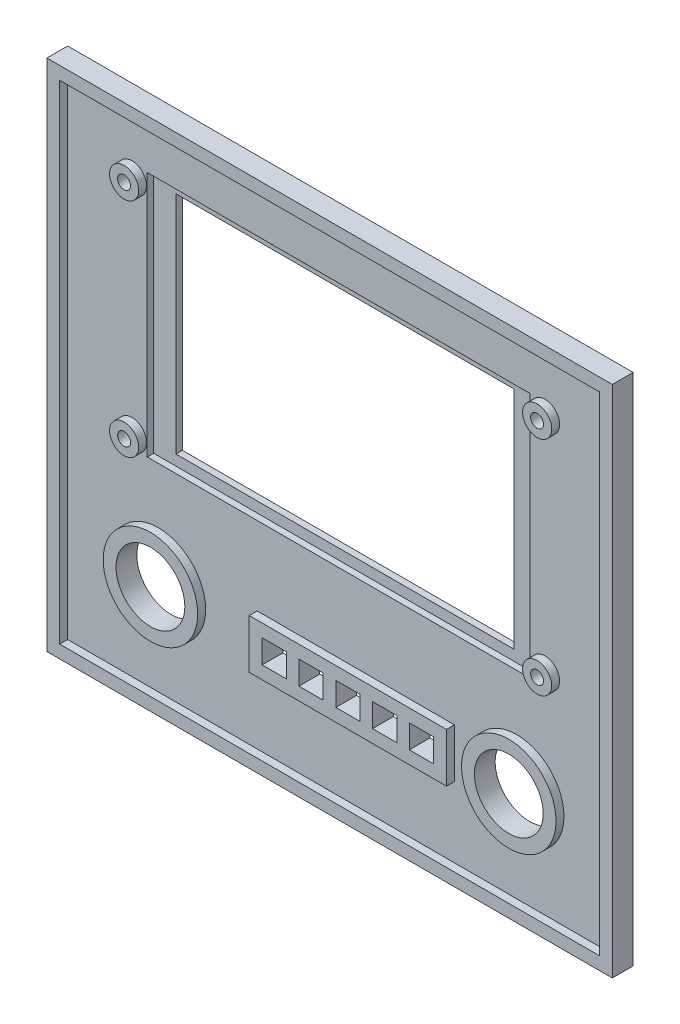
from build123d import *

# Parameters (mm, degrees)
SKETCH1_W           = 139.7
SKETCH1_H           = 127
SKETCH1_W_2         = 83.52
SKETCH1_H_2         = 55.68
SKETCH1_R           = 8.5
SKETCH1_W_3         = 6
SKETCH1_H_3         = 5.8
BOSS_EXTRUDE1_DEPTH = 5.1375
SKETCH2_W           = 94.57
SKETCH2_H           = 60.88
SKETCH2_W_2         = 83.52
SKETCH2_H_2         = 55.68
CUT_EXTRUDE1_DEPTH  = 3.55
SKETCH3_R           = 1.6
SKETCH3_R_2         = 1.6002
CUT_EXTRUDE2_DEPTH  = 10
SKETCH4_W           = 133.35
SKETCH4_H           = 120.65
SKETCH4_R           = 11.675
SKETCH4_R_2         = 3.6002
SKETCH4_W_2         = 48.72234
SKETCH4_H_2         = 12.15
SKETCH4_R_3         = 3.6
SKETCH4_W_3         = 94.57
SKETCH4_H_3         = 60.88
CUT_EXTRUDE3_DEPTH  = 1.9625
CUT_EXTRUDE6_DEPTH  = 1.5875


with BuildPart() as part:
    # Sketch1 → Boss-Extrude1 (new body)
    with BuildSketch(Plane.XY):
        with Locations((-0.265452364, -19.000597583)):
            Rectangle(SKETCH1_W, SKETCH1_H)
        Rectangle(SKETCH1_W_2, SKETCH1_H_2, mode=Mode.SUBTRACT)
        with Locations((-44.535112364, -55.869967583)):
            Circle(SKETCH1_R, mode=Mode.SUBTRACT)
        with Locations((-13.945692364, -55.869967583)):
            Rectangle(SKETCH1_W_3, SKETCH1_H_3, mode=Mode.SUBTRACT)
        with Locations((-4.851972364, -55.869967583)):
            Rectangle(SKETCH1_W_3, SKETCH1_H_3, mode=Mode.SUBTRACT)
        with Locations((4.267147636, -55.869967583)):
            Rectangle(SKETCH1_W_3, SKETCH1_H_3, mode=Mode.SUBTRACT)
        with Locations((13.332927636, -55.869967583)):
            Rectangle(SKETCH1_W_3, SKETCH1_H_3, mode=Mode.SUBTRACT)
        with Locations((22.426647636, -55.869967583)):
            Rectangle(SKETCH1_W_3, SKETCH1_H_3, mode=Mode.SUBTRACT)
        with Locations((44.004207636, -55.869967583)):
            Circle(SKETCH1_R, mode=Mode.SUBTRACT)
    extrude(amount=BOSS_EXTRUDE1_DEPTH)

    # Sketch2 → Cut-Extrude1 (cut)
    with BuildSketch(Plane.XY.offset(5.1375)):
        Rectangle(SKETCH2_W, SKETCH2_H)
        Rectangle(SKETCH2_W_2, SKETCH2_H_2, mode=Mode.SUBTRACT)
    extrude(amount=-CUT_EXTRUDE1_DEPTH, mode=Mode.SUBTRACT)

    # Sketch3 → Cut-Extrude2 (cut)
    with BuildSketch(Plane.XY.offset(5.1375)):
        with Locations((51.005027636, -27.450347583)):
            Circle(SKETCH3_R)
        with Locations((-51.034972364, 27.449652417)):
            Circle(SKETCH3_R)
        with Locations((51.005027636, 27.449652417)):
            Circle(SKETCH3_R)
        with Locations((-51.034972364, -27.449907583)):
            Circle(SKETCH3_R_2)
    extrude(amount=-CUT_EXTRUDE2_DEPTH, mode=Mode.SUBTRACT)

    # Sketch4 → Cut-Extrude3 (cut)
    with BuildSketch(Plane.XY.offset(5.1375)):
        with Locations((-0.265452364, -19.000597583)):
            Rectangle(SKETCH4_W, SKETCH4_H)
        with Locations((-44.535112364, -55.869967583)):
            Circle(SKETCH4_R, mode=Mode.SUBTRACT)
        with Locations((-51.034972364, -27.449907583)):
            Circle(SKETCH4_R_2, mode=Mode.SUBTRACT)
        with Locations((4.240477636, -55.869967583)):
            Rectangle(SKETCH4_W_2, SKETCH4_H_2, mode=Mode.SUBTRACT)
        with Locations((44.004207636, -55.869967583)):
            Circle(SKETCH4_R, mode=Mode.SUBTRACT)
        with Locations((51.005027636, -27.450347583)):
            Circle(SKETCH4_R_3, mode=Mode.SUBTRACT)
        with Locations((-51.034972364, 27.449652417)):
            Circle(SKETCH4_R_3, mode=Mode.SUBTRACT)
        Rectangle(SKETCH4_W_3, SKETCH4_H_3, mode=Mode.SUBTRACT)
        with Locations((51.005027636, 27.449652417)):
            Circle(SKETCH4_R_3, mode=Mode.SUBTRACT)
    extrude(amount=-CUT_EXTRUDE3_DEPTH, mode=Mode.SUBTRACT)

    # Text 2 → Cut-Extrude6 (cut)
    # profile 1 of 11: a face of its own
    with BuildSketch(Plane(origin=(0, 0, 0), x_dir=(-1, 0, 0), z_dir=(0, 0, -1))):
        with BuildLine():
            Line((-33.286786442, 32.553506894), (-33.281189427, 32.385596446))
            Line((-33.281189427, 32.385596446), (-32.736413307, 32.391193461))
            Line((-32.736413307, 32.391193461), (-32.197234203, 32.379999432))
            Line((-32.197234203, 32.379999432), (-31.889398382, 32.413581521))
            Line((-31.889398382, 32.413581521), (-30.51253271, 32.396790476))
            Line((-30.51253271, 32.396790476), (-29.904323755, 32.413581521))
            Line((-29.904323755, 32.413581521), (-29.333428233, 32.379999432))
            Line((-29.333428233, 32.379999432), (-28.544249128, 32.449029282))
            Line((-28.544249128, 32.449029282), (-28.275592412, 32.449029282))
            Line((-28.275592412, 32.449029282), (-27.353950621, 32.499402417))
            add(Edge.make_bspline(
                [(-27.353950621, 32.499402417), (-27.153688957, 32.496846574), (-26.862669876, 32.503090469), (-26.487014765, 32.499778752), (-26.23394155, 32.505861934), (-26.000077082, 32.506032926), (-25.726460081, 32.511827452), (-25.530560145, 32.515139622), (-25.406189427, 32.518059133)],
                knots=[0.84100826, 0.84100826, 0.84100826, 0.84100826, 1.149416994, 1.289253103, 1.41952548, 1.539252007, 1.649413543, 1.84100826, 1.84100826, 1.84100826, 1.84100826], degree=3))
            add(Edge.make_bspline(
                [(-24.928577487, 34.516193461), (-24.944045364, 34.434933235), (-24.976602703, 34.292068245), (-25.026565467, 34.073199491), (-25.081483244, 33.844531847), (-25.146146148, 33.573234911), (-25.255743826, 33.12612677), (-25.343569251, 32.769818952), (-25.406189427, 32.518059133)],
                knots=[0, 0, 0, 0, 0.120762569, 0.21394122, 0.327813543, 0.464149196, 0.62118358, 1, 1, 1, 1], degree=3))
            add(Edge.make_bspline(
                [(-25.059174501, 34.529253163), (-24.993364899, 34.5279016), (-24.928577487, 34.516193461)],
                knots=[0, 0, 0, 1, 1, 1], degree=2))
            Line((-25.059174501, 34.529253163), (-25.167383457, 34.529253163))
            add(Edge.make_bspline(
                [(-25.894995397, 33.38932779), (-25.733153452, 33.522623661), (-25.440418223, 33.878162484), (-25.249428514, 34.296359769), (-25.167383457, 34.529253163)],
                knots=[0, 0, 0, 0, 0.457872477, 1, 1, 1, 1], degree=3))
            add(Edge.make_bspline(
                [(-27.288652113, 32.786715849), (-27.035026491, 32.82330776), (-26.533416436, 32.953867019), (-26.093157737, 33.227924307), (-25.894995397, 33.38932779)],
                knots=[0, 0, 0, 0, 0.500821606, 1, 1, 1, 1], degree=3))
            add(Edge.make_bspline(
                [(-27.581562561, 32.745671073), (-27.435732126, 32.77060092), (-27.288652113, 32.786715849)],
                knots=[0, 0, 0, 1, 1, 1], degree=2))
            add(Edge.make_bspline(
                [(-28.393129725, 32.665447193), (-28.265369208, 32.665940939), (-27.993510548, 32.682595854), (-27.723612567, 32.719226319), (-27.581562561, 32.745671073)],
                knots=[0, 0, 0, 0, 0.469239942, 1, 1, 1, 1], degree=3))
            Line((-28.393129725, 32.665447193), (-28.553577487, 32.672909879))
            Line((-28.553577487, 32.672909879), (-28.790517785, 32.659850178))
            Line((-28.790517785, 32.659850178), (-29.76253271, 32.613208387))
            add(Edge.make_bspline(
                [(-29.867010322, 32.618805402), (-29.814828044, 32.614921445), (-29.76253271, 32.613208387)],
                knots=[0, 0, 0, 1, 1, 1], degree=2))
            add(Edge.make_bspline(
                [(-30.172980472, 32.626268088), (-30.133780384, 32.627127725), (-30.031816835, 32.622840762), (-29.929776095, 32.622402881), (-29.867010322, 32.618805402)],
                knots=[0, 0, 0, 0, 0.384087448, 1, 1, 1, 1], degree=3))
            add(Edge.make_bspline(
                [(-30.868875994, 32.840820327), (-30.799605803, 32.774235219), (-30.699272607, 32.685921908), (-30.544122293, 32.653551446), (-30.394171141, 32.631170932), (-30.266099938, 32.629899624), (-30.172980472, 32.626268088)],
                knots=[0, 0, 0, 0, 0.396115564, 0.49281202, 0.627983095, 1, 1, 1, 1], degree=3))
            add(Edge.make_bspline(
                [(-30.911786442, 33.021790476), (-30.906229377, 32.927700861), (-30.868875994, 32.840820327)],
                knots=[0, 0, 0, 1, 1, 1], degree=2))
            add(Edge.make_bspline(
                [(-30.893129725, 33.243805402), (-30.908505039, 33.133293179), (-30.911786442, 33.021790476)],
                knots=[0, 0, 0, 1, 1, 1], degree=2))
            Line((-30.893129725, 33.243805402), (-30.572234203, 35.120671073))
            add(Edge.make_bspline(
                [(-30.389398382, 35.956491969), (-30.429863518, 35.799904515), (-30.494811072, 35.522116627), (-30.553046558, 35.242786539), (-30.572234203, 35.120671073)],
                knots=[0, 0, 0, 0, 0.566856827, 1, 1, 1, 1], degree=3))
            add(Edge.make_bspline(
                [(-30.238278979, 36.678506894), (-30.266715255, 36.532219505), (-30.312958413, 36.29064855), (-30.36789946, 36.050935944), (-30.389398382, 35.956491969)],
                knots=[0, 0, 0, 0, 0.606091293, 1, 1, 1, 1], degree=3))
            add(Edge.make_bspline(
                [(-30.081562561, 36.684103909), (-30.15994953, 36.682134108), (-30.238278979, 36.678506894)],
                knots=[0, 0, 0, 1, 1, 1], degree=2))
            add(Edge.make_bspline(
                [(-29.812905845, 36.693432267), (-29.947512592, 36.695946156), (-30.081562561, 36.684103909)],
                knots=[0, 0, 0, 1, 1, 1], degree=2))
            Line((-29.812905845, 36.693432267), (-29.69350286, 36.702760626))
            Line((-29.69350286, 36.702760626), (-29.256935695, 36.71955167))
            add(Edge.make_bspline(
                [(-27.94350286, 36.75313376), (-28.130140218, 36.754402249), (-28.567942952, 36.741129681), (-29.005817582, 36.731783383), (-29.256935695, 36.71955167)],
                knots=[0, 0, 0, 0, 0.426049285, 1, 1, 1, 1], degree=3))
            add(Edge.make_bspline(
                [(-26.89872674, 36.797909879), (-27.058682792, 36.800171638), (-27.407103041, 36.785967207), (-27.755386825, 36.769725878), (-27.94350286, 36.75313376)],
                knots=[0, 0, 0, 0, 0.458570158, 1, 1, 1, 1], degree=3))
            add(Edge.make_bspline(
                [(-26.191637188, 36.102014357), (-26.190238279, 36.219995206), (-26.200283126, 36.382524629), (-26.257937971, 36.570325169), (-26.31877267, 36.666649965), (-26.41458541, 36.731057787), (-26.608043721, 36.79096013), (-26.776906112, 36.794426629), (-26.89872674, 36.797909879)],
                knots=[0, 0, 0, 0, 0.298410529, 0.406061381, 0.493080938, 0.579703662, 0.690830371, 1, 1, 1, 1], degree=3))
            add(Edge.make_bspline(
                [(-26.223353606, 35.652387491), (-26.211820471, 35.710911364), (-26.191405084, 35.860362254), (-26.193037348, 36.011303917), (-26.191637188, 36.102014357)],
                knots=[0, 0, 0, 0, 0.396386732, 1, 1, 1, 1], degree=3))
            add(Edge.make_bspline(
                [(-26.242010322, 35.529253163), (-26.235743492, 35.591265088), (-26.223353606, 35.652387491)],
                knots=[0, 0, 0, 1, 1, 1], degree=2))
            Line((-26.242010322, 35.529253163), (-26.234547636, 35.497536745))
            add(Edge.make_bspline(
                [(-26.003204352, 35.484477043), (-26.118574972, 35.496377912), (-26.234547636, 35.497536745)],
                knots=[0, 0, 0, 1, 1, 1], degree=2))
            add(Edge.make_bspline(
                [(-25.94350286, 35.842685999), (-25.955362798, 35.772844282), (-25.962530183, 35.651282106), (-25.992293597, 35.533477281), (-26.003204352, 35.484477043)],
                knots=[0, 0, 0, 0, 0.585156214, 1, 1, 1, 1], degree=3))
            add(Edge.make_bspline(
                [(-25.906189427, 36.070297939), (-25.926795972, 35.95680906), (-25.94350286, 35.842685999)],
                knots=[0, 0, 0, 1, 1, 1], degree=2))
            add(Edge.make_bspline(
                [(-25.80730883, 36.602014357), (-25.818378358, 36.53099938), (-25.847601359, 36.35305792), (-25.8836193, 36.176342567), (-25.906189427, 36.070297939)],
                knots=[0, 0, 0, 0, 0.398632304, 1, 1, 1, 1], degree=3))
            add(Edge.make_bspline(
                [(-25.753204352, 36.960223312), (-25.789984702, 36.782626522), (-25.80730883, 36.602014357)],
                knots=[0, 0, 0, 1, 1, 1], degree=2))
            add(Edge.make_bspline(
                [(-25.525592412, 38.350148685), (-25.53771289, 38.273875473), (-25.551675155, 38.148909463), (-25.581103601, 37.970197026), (-25.606003563, 37.806338498), (-25.639487074, 37.62338304), (-25.684316668, 37.338450722), (-25.72666643, 37.115832999), (-25.753204352, 36.960223312)],
                knots=[0, 0, 0, 0, 0.164466429, 0.267685777, 0.385709612, 0.517451377, 0.663779689, 1, 1, 1, 1], degree=3))
            Line((-25.525592412, 38.350148685), (-25.764398382, 38.312835252))
            add(Edge.make_bspline(
                [(-26.609547636, 37.036715849), (-26.535258477, 37.060837586), (-26.428851812, 37.10447369), (-26.308309586, 37.190843257), (-26.243014172, 37.253828707), (-26.195613645, 37.322899439), (-26.15446394, 37.397430224), (-26.102959094, 37.492994307), (-26.04765742, 37.612874315), (-25.987475487, 37.756161578), (-25.887433227, 37.990129456), (-25.817275558, 38.180027421), (-25.764398382, 38.312835252)],
                knots=[0, 0, 0, 0, 0.14748393, 0.213739204, 0.278287687, 0.316926136, 0.370926199, 0.438461145, 0.521182502, 0.619224718, 0.730946311, 1, 1, 1, 1], degree=3))
            add(Edge.make_bspline(
                [(-28.460293904, 36.975148685), (-28.204103366, 36.983067025), (-27.845835541, 36.99080078), (-27.401806807, 37.004121514), (-27.145613872, 37.013629038), (-26.939163678, 37.02151829), (-26.766170734, 37.026585273), (-26.661737332, 37.032867666), (-26.609547636, 37.036715849)],
                knots=[0, 0, 0, 0, 0.415223496, 0.580524482, 0.71964584, 0.830540206, 0.915221197, 1, 1, 1, 1], degree=3))
            add(Edge.make_bspline(
                [(-30.200965546, 36.917312864), (-30.125177869, 36.922734782), (-29.994484854, 36.92686469), (-29.79681561, 36.93748126), (-29.596459712, 36.941337314), (-29.36140045, 36.949238491), (-28.979040314, 36.963842806), (-28.674780797, 36.967231234), (-28.460293904, 36.975148685)],
                knots=[0, 0, 0, 0, 0.130845226, 0.225206262, 0.340938162, 0.475974645, 0.630317302, 1, 1, 1, 1], degree=3))
            add(Edge.make_bspline(
                [(-30.18230883, 37.111342715), (-30.188646073, 37.014042041), (-30.200965546, 36.917312864)],
                knots=[0, 0, 0, 1, 1, 1], degree=2))
            add(Edge.make_bspline(
                [(-29.993875994, 38.213954655), (-30.014659579, 38.093518618), (-30.052953601, 37.921101549), (-30.089077203, 37.698818906), (-30.117349538, 37.554503044), (-30.13646291, 37.423458161), (-30.160565779, 37.277671348), (-30.174728165, 37.174922114), (-30.18230883, 37.111342715)],
                knots=[0, 0, 0, 0, 0.327697686, 0.473271691, 0.603777817, 0.721938492, 0.828309113, 1, 1, 1, 1], degree=3))
            Line((-29.993875994, 38.213954655), (-29.975219278, 38.402387491))
            Line((-29.975219278, 38.402387491), (-29.842756591, 39.167312864))
            Line((-29.842756591, 39.167312864), (-29.691637188, 39.990074058))
            add(Edge.make_bspline(
                [(-29.611413307, 40.359477043), (-29.641035582, 40.172537098), (-29.691637188, 39.990074058)],
                knots=[0, 0, 0, 1, 1, 1], degree=2))
            add(Edge.make_bspline(
                [(-29.39872674, 40.441566596), (-29.506848876, 40.405197267), (-29.611413307, 40.359477043)],
                knots=[0, 0, 0, 1, 1, 1], degree=2))
            add(Edge.make_bspline(
                [(-29.109547636, 40.482611372), (-29.255610836, 40.47230061), (-29.39872674, 40.441566596)],
                knots=[0, 0, 0, 1, 1, 1], degree=2))
            Line((-29.109547636, 40.482611372), (-28.482681964, 40.499402417))
            Line((-28.482681964, 40.499402417), (-28.325965546, 40.499402417))
            Line((-28.325965546, 40.499402417), (-28.094622263, 40.51432779))
            Line((-28.094622263, 40.51432779), (-27.993875994, 40.51432779))
            Line((-27.993875994, 40.51432779), (-27.755070024, 40.529253163))
            Line((-27.755070024, 40.529253163), (-27.630070024, 40.51432779))
            Line((-27.630070024, 40.51432779), (-27.279323755, 40.529253163))
            Line((-27.279323755, 40.529253163), (-26.790517785, 40.529253163))
            Line((-26.790517785, 40.529253163), (-26.357681964, 40.603880029))
            Line((-26.357681964, 40.603880029), (-26.158055098, 40.588954655))
            Line((-26.158055098, 40.588954655), (-25.993875994, 40.618805402))
            add(Edge.make_bspline(
                [(-25.756935695, 40.618805402), (-25.875488177, 40.603768115), (-25.993875994, 40.618805402)],
                knots=[0, 0, 0, 1, 1, 1], degree=2))
            add(Edge.make_bspline(
                [(-25.562905845, 40.600148685), (-25.660071724, 40.607891324), (-25.756935695, 40.618805402)],
                knots=[0, 0, 0, 1, 1, 1], degree=2))
            add(Edge.make_bspline(
                [(-25.210293904, 40.555372566), (-25.385140038, 40.589484074), (-25.562905845, 40.600148685)],
                knots=[0, 0, 0, 1, 1, 1], degree=2))
            add(Edge.make_bspline(
                [(-25.122607337, 40.008730775), (-25.13335959, 40.088494199), (-25.129111816, 40.193330583), (-25.144528421, 40.309014996), (-25.147575349, 40.354746287), (-25.154996612, 40.39105629), (-25.176697841, 40.456737001), (-25.19556047, 40.513202234), (-25.210293904, 40.555372566)],
                knots=[0, 0, 0, 0, 0.432733466, 0.560661207, 0.627955617, 0.679170506, 0.759662414, 1, 1, 1, 1], degree=3))
            add(Edge.make_bspline(
                [(-25.047980472, 39.508730775), (-25.066401081, 39.614291393), (-25.094534891, 39.780471736), (-25.117844191, 39.947472842), (-25.122607337, 40.008730775)],
                knots=[0, 0, 0, 0, 0.635670578, 1, 1, 1, 1], degree=3))
            add(Edge.make_bspline(
                [(-24.809174501, 39.424775551), (-24.940016962, 39.434843116), (-25.047980472, 39.508730775)],
                knots=[0, 0, 0, 1, 1, 1], degree=2))
            add(Edge.make_bspline(
                [(-24.676711815, 40.049775551), (-24.694306455, 39.934225891), (-24.730967033, 39.724198392), (-24.780151592, 39.516640732), (-24.809174501, 39.424775551)],
                knots=[0, 0, 0, 0, 0.548362186, 1, 1, 1, 1], degree=3))
            add(Edge.make_bspline(
                [(-24.570368531, 40.838954655), (-24.573292468, 40.801632575), (-24.577625083, 40.738620741), (-24.589419237, 40.645428161), (-24.602948557, 40.554163943), (-24.617641115, 40.448408798), (-24.64099256, 40.278409507), (-24.663462797, 40.144459365), (-24.676711815, 40.049775551)],
                knots=[0, 0, 0, 0, 0.141027934, 0.237774135, 0.353712574, 0.488532822, 0.639915661, 1, 1, 1, 1], degree=3))
            add(Edge.make_bspline(
                [(-24.801711815, 40.84455167), (-24.686104451, 40.839225036), (-24.570368531, 40.838954655)],
                knots=[0, 0, 0, 1, 1, 1], degree=2))
            add(Edge.make_bspline(
                [(-25.083428233, 40.857611372), (-24.94228669, 40.857104064), (-24.801711815, 40.84455167)],
                knots=[0, 0, 0, 1, 1, 1], degree=2))
            Line((-25.083428233, 40.857611372), (-29.478950621, 40.732611372))
            Line((-29.478950621, 40.732611372), (-29.997607337, 40.754999432))
            Line((-29.997607337, 40.754999432), (-30.928577487, 40.738208387))
            Line((-30.928577487, 40.738208387), (-31.691637188, 40.738208387))
            add(Edge.make_bspline(
                [(-31.734547636, 40.521790476), (-31.729255337, 40.633185691), (-31.691637188, 40.738208387)],
                knots=[0, 0, 0, 1, 1, 1], degree=2))
            Line((-31.734547636, 40.521790476), (-31.342756591, 40.499402417))
            add(Edge.make_bspline(
                [(-30.536786442, 40.157984506), (-30.534724153, 40.20331771), (-30.547240639, 40.269564818), (-30.593286567, 40.34351581), (-30.633282481, 40.380664472), (-30.678204309, 40.405519219), (-30.728428472, 40.42113394), (-30.792467197, 40.437664909), (-30.872849123, 40.45277656), (-30.968320948, 40.464410273), (-31.126525234, 40.484395053), (-31.253276808, 40.491475692), (-31.342756591, 40.499402417)],
                knots=[0, 0, 0, 0, 0.139618116, 0.200721959, 0.265779485, 0.305214096, 0.357905841, 0.427115423, 0.508996346, 0.609480538, 0.723264746, 1, 1, 1, 1], degree=3))
            add(Edge.make_bspline(
                [(-30.542383457, 39.988208387), (-30.537782503, 40.073037242), (-30.536786442, 40.157984506)],
                knots=[0, 0, 0, 1, 1, 1], degree=2))
            add(Edge.make_bspline(
                [(-30.628204352, 39.312835252), (-30.608707921, 39.413061973), (-30.568862642, 39.636926438), (-30.553576365, 39.863847369), (-30.542383457, 39.988208387)],
                knots=[0, 0, 0, 0, 0.449811607, 1, 1, 1, 1], degree=3))
            Line((-30.628204352, 39.312835252), (-30.82969689, 38.254999432))
            add(Edge.make_bspline(
                [(-30.922980472, 37.629999432), (-30.91780503, 37.652222309), (-30.910419522, 37.693300049), (-30.899803972, 37.758078996), (-30.88802491, 37.828807995), (-30.878287517, 37.915010823), (-30.85482727, 38.058168718), (-30.843541839, 38.173898552), (-30.82969689, 38.254999432)],
                knots=[0, 0, 0, 0, 0.108267981, 0.19804379, 0.311602205, 0.448535669, 0.609673159, 1, 1, 1, 1], degree=3))
            Line((-30.922980472, 37.629999432), (-31.301711815, 35.493805402))
            add(Edge.make_bspline(
                [(-31.743875994, 33.103880029), (-31.695022874, 33.363501209), (-31.619112866, 33.737155045), (-31.529828236, 34.216538152), (-31.469207951, 34.530301997), (-31.41704069, 34.813904784), (-31.360769964, 35.131542663), (-31.324262055, 35.355049697), (-31.301711815, 35.493805402)],
                knots=[0, 0, 0, 0, 0.326061353, 0.470581667, 0.601852688, 0.720487098, 0.826490278, 1, 1, 1, 1], degree=3))
            add(Edge.make_bspline(
                [(-31.801711815, 32.751268088), (-31.768300449, 32.926830623), (-31.743875994, 33.103880029)],
                knots=[0, 0, 0, 1, 1, 1], degree=2))
            add(Edge.make_bspline(
                [(-32.281189427, 32.618805402), (-32.213157352, 32.635914735), (-32.053210931, 32.679669189), (-31.893227304, 32.723298251), (-31.801711815, 32.751268088)],
                knots=[0, 0, 0, 0, 0.423015018, 1, 1, 1, 1], degree=3))
            Line((-32.281189427, 32.618805402), (-32.684174501, 32.575894954))
            Line((-32.684174501, 32.575894954), (-33.286786442, 32.553506894))
        make_face()
    # profile 2 of 11: a face of its own
    with BuildSketch(Plane(origin=(0, 0, 0), x_dir=(-1, 0, 0), z_dir=(0, 0, -1))):
        with BuildLine():
            add(Edge.make_bspline(
                [(23.659499968, 32.499402417), (23.591940444, 32.549969065), (23.53354573, 32.613502373), (23.483735946, 32.680372566)],
                knots=[0.604893955, 0.604893955, 0.604893955, 0.604893955, 1, 1, 1, 1], degree=3))
            Line((23.659499968, 32.499402417), (24.517448135, 32.499402417))
            add(Edge.make_bspline(
                [(24.933362812, 32.796044208), (24.810611699, 32.677878176), (24.671301961, 32.574004427), (24.517448135, 32.499402417)],
                knots=[0, 0, 0, 0, 0.499177828, 0.499177828, 0.499177828, 0.499177828], degree=3))
            add(Edge.make_bspline(
                [(25.81769117, 34.157984506), (25.789555693, 34.038602973), (25.722485676, 33.864185732), (25.609985962, 33.638424278), (25.507864712, 33.466878005), (25.389472406, 33.296118653), (25.201170972, 33.067184853), (25.045805946, 32.902062795), (24.933362812, 32.796044208)],
                knots=[0, 0, 0, 0, 0.223060844, 0.339726886, 0.459746567, 0.586861464, 0.718300229, 1, 1, 1, 1], degree=3))
            add(Edge.make_bspline(
                [(25.660974752, 34.171044208), (25.739737877, 34.169468306), (25.81769117, 34.157984506)],
                knots=[0, 0, 0, 1, 1, 1], degree=2))
            Line((25.660974752, 34.171044208), (25.5788852, 34.171044208))
            add(Edge.make_bspline(
                [(24.56769117, 33.027387491), (24.707812632, 33.090105958), (24.905348221, 33.217063183), (25.130491256, 33.448123177), (25.364460638, 33.73145368), (25.510557443, 33.983685814), (25.5788852, 34.171044208)],
                knots=[0, 0, 0, 0, 0.294767653, 0.445134684, 0.618291654, 1, 1, 1, 1], degree=3))
            add(Edge.make_bspline(
                [(24.330750872, 32.977014357), (24.45481377, 32.976332819), (24.56769117, 33.027387491)],
                knots=[0, 0, 0, 1, 1, 1], degree=2))
            add(Edge.make_bspline(
                [(23.981870275, 33.143059133), (24.022783006, 33.092584282), (24.125942292, 32.99855073), (24.264153513, 32.979311872), (24.330750872, 32.977014357)],
                knots=[0, 0, 0, 0, 0.492884911, 1, 1, 1, 1], degree=3))
            add(Edge.make_bspline(
                [(23.787840424, 33.792312864), (23.790265833, 33.670409193), (23.810755801, 33.437290721), (23.916361462, 33.228109826), (23.981870275, 33.143059133)],
                knots=[0, 0, 0, 0, 0.533450207, 1, 1, 1, 1], degree=3))
            add(Edge.make_bspline(
                [(23.981870275, 34.887462118), (23.920106655, 34.709964144), (23.818955877, 34.349612502), (23.790012673, 33.976480294), (23.787840424, 33.792312864)],
                knots=[0, 0, 0, 0, 0.505086726, 1, 1, 1, 1], degree=3))
            add(Edge.make_bspline(
                [(25.444556842, 35.273656148), (25.392083293, 35.249422325), (25.290970026, 35.217099527), (25.132994506, 35.164714375), (24.960474721, 35.113806999), (24.757405952, 35.054818144), (24.427477801, 34.978695381), (24.166313583, 34.921418055), (23.981870275, 34.887462118)],
                knots=[0, 0, 0, 0, 0.114221411, 0.210032761, 0.329649627, 0.470401997, 0.628722891, 1, 1, 1, 1], degree=3))
            Line((25.444556842, 35.273656148), (25.966944902, 35.603880029))
            add(Edge.make_bspline(
                [(26.534109081, 36.751268088), (26.533474574, 36.63818551), (26.511971224, 36.465809288), (26.433599072, 36.246267524), (26.356074855, 36.085061951), (26.266982783, 35.935378493), (26.14475413, 35.767922308), (26.043986952, 35.658680607), (25.966944902, 35.603880029)],
                knots=[0, 0, 0, 0, 0.257451517, 0.390779742, 0.528726437, 0.663866199, 0.786391646, 1, 1, 1, 1], degree=3))
            add(Edge.make_bspline(
                [(25.776646394, 37.633730775), (25.875252804, 37.637462503), (26.021681176, 37.599537987), (26.195170988, 37.494368137), (26.310830696, 37.383701107), (26.409767605, 37.251965964), (26.512313585, 37.045492128), (26.531191987, 36.868389535), (26.534109081, 36.751268088)],
                knots=[0, 0, 0, 0, 0.226862089, 0.343661434, 0.468465372, 0.596575947, 0.725264571, 1, 1, 1, 1], degree=3))
            add(Edge.make_bspline(
                [(24.890452364, 37.25313376), (25.021749885, 37.364212617), (25.293265988, 37.559728255), (25.620677364, 37.634627761), (25.776646394, 37.633730775)],
                knots=[0, 0, 0, 0, 0.526728522, 1, 1, 1, 1], degree=3))
            add(Edge.make_bspline(
                [(24.373661319, 36.704626297), (24.441743292, 36.778932874), (24.537950547, 36.882961052), (24.658167326, 37.011521021), (24.729529729, 37.086326399), (24.787651364, 37.14763219), (24.837929347, 37.203616551), (24.871546319, 37.236651349), (24.890452364, 37.25313376)],
                knots=[0, 0, 0, 0, 0.401118013, 0.563976103, 0.700540619, 0.81261142, 0.900193995, 1, 1, 1, 1], degree=3))
            Line((24.373661319, 36.704626297), (23.899780722, 36.004999432))
            add(Edge.make_bspline(
                [(23.485601618, 35.182238238), (23.665090096, 35.607527854), (23.899780722, 36.004999432)],
                knots=[0, 0, 0, 1, 1, 1], degree=2))
            add(Edge.make_bspline(
                [(23.190825499, 33.76432779), (23.191143576, 33.874769464), (23.204356427, 34.047807494), (23.240781339, 34.286815768), (23.279168124, 34.482781261), (23.324722325, 34.67816103), (23.388733678, 34.912935439), (23.443141301, 35.07940631), (23.485601618, 35.182238238)],
                knots=[0, 0, 0, 0, 0.227587362, 0.357248774, 0.498327486, 0.639225436, 0.770806464, 1, 1, 1, 1], degree=3))
            add(Edge.make_bspline(
                [(23.483735946, 32.680372566), (23.379092604, 32.81904459), (23.223518723, 33.1731009), (23.19293611, 33.557405909), (23.190825499, 33.76432779)],
                knots=[0, 0, 0, 0, 0.454038087, 1, 1, 1, 1], degree=3))
        make_face()
        with BuildLine():
            add(Edge.make_bspline(
                [(24.080750872, 35.126268088), (24.162475542, 35.125312066), (24.363818648, 35.163717456), (24.553989569, 35.238189552), (24.668437439, 35.281118835)],
                knots=[0, 0, 0, 0, 0.399136617, 1, 1, 1, 1], degree=3))
            add(Edge.make_bspline(
                [(24.474407588, 36.085223312), (24.384739514, 35.908793188), (24.238627626, 35.59481732), (24.118926747, 35.269626409), (24.080750872, 35.126268088)],
                knots=[0, 0, 0, 0, 0.571830215, 1, 1, 1, 1], degree=3))
            add(Edge.make_bspline(
                [(25.23746729, 37.202760626), (25.095535221, 37.069646303), (24.811400178, 36.713904191), (24.593957218, 36.314634307), (24.474407588, 36.085223312)],
                knots=[0, 0, 0, 0, 0.428390459, 1, 1, 1, 1], degree=3))
            add(Edge.make_bspline(
                [(25.614332961, 37.394924805), (25.552593682, 37.395828845), (25.415167969, 37.345083834), (25.300469997, 37.256872963), (25.23746729, 37.202760626)],
                knots=[0, 0, 0, 0, 0.421328582, 1, 1, 1, 1], degree=3))
            add(Edge.make_bspline(
                [(25.937094155, 36.9807457), (25.937427592, 37.036032327), (25.927990103, 37.118065936), (25.88299254, 37.215777368), (25.838535631, 37.27691357), (25.789923301, 37.330192545), (25.716600961, 37.377464086), (25.655593937, 37.395548366), (25.614332961, 37.394924805)],
                knots=[0, 0, 0, 0, 0.287356731, 0.418425554, 0.552387387, 0.677593808, 0.789192569, 1, 1, 1, 1], degree=3))
            add(Edge.make_bspline(
                [(25.243064305, 35.620671073), (25.298897108, 35.659156541), (25.37691572, 35.735397168), (25.483173058, 35.849389566), (25.597514285, 35.995251797), (25.730884839, 36.191095947), (25.886021931, 36.528364106), (25.937530441, 36.800047666), (25.937094155, 36.9807457)],
                knots=[0, 0, 0, 0, 0.128486615, 0.207259841, 0.296575798, 0.48113696, 0.657036317, 1, 1, 1, 1], degree=3))
            add(Edge.make_bspline(
                [(24.668437439, 35.281118835), (24.756042022, 35.316641941), (24.952193546, 35.423270936), (25.13824137, 35.546254378), (25.243064305, 35.620671073)],
                knots=[0, 0, 0, 0, 0.423325065, 1, 1, 1, 1], degree=3))
        make_face(mode=Mode.SUBTRACT)
    # profile 3 of 11: a face of its own
    with BuildSketch(Plane(origin=(0, 0, 0), x_dir=(-1, 0, 0), z_dir=(0, 0, -1))):
        with BuildLine():
            add(Edge.make_bspline(
                [(17.708287716, 32.499402417), (17.709826566, 32.505647217), (17.724605025, 32.561158058), (17.745443367, 32.614702539), (17.759855349, 32.663581521)],
                knots=[0.271982234, 0.271982234, 0.271982234, 0.271982234, 0.353534404, 1, 1, 1, 1], degree=3))
            Line((17.708287716, 32.499402417), (18.321634136, 32.499402417))
            add(Edge.make_bspline(
                [(18.382989678, 32.587088984), (18.356329146, 32.539252703), (18.321634136, 32.499402417)],
                knots=[0, 0, 0, 0.391798578, 0.391798578, 0.391798578], degree=2))
            add(Edge.make_bspline(
                [(19.55649714, 34.671044208), (19.33378877, 34.334986727), (18.917686587, 33.653562927), (18.550871777, 32.944399343), (18.382989678, 32.587088984)],
                knots=[0, 0, 0, 0, 0.505249168, 1, 1, 1, 1], degree=3))
            add(Edge.make_bspline(
                [(20.593810573, 36.029253163), (20.472590857, 35.883943763), (20.302903646, 35.671471008), (20.084102346, 35.402127318), (19.950062198, 35.221163322), (19.824666168, 35.062563366), (19.695874492, 34.880401737), (19.60716585, 34.752533322), (19.55649714, 34.671044208)],
                knots=[0, 0, 0, 0, 0.331938439, 0.477113057, 0.608695999, 0.726972542, 0.831735605, 1, 1, 1, 1], degree=3))
            add(Edge.make_bspline(
                [(21.59007923, 36.956491969), (21.417050824, 36.8542475), (21.065488252, 36.561899264), (20.756180074, 36.226438791), (20.593810573, 36.029253163)],
                knots=[0, 0, 0, 0, 0.439485825, 1, 1, 1, 1], degree=3))
            add(Edge.make_bspline(
                [(21.815825499, 37.036715849), (21.692793958, 37.026680935), (21.59007923, 36.956491969)],
                knots=[0, 0, 0, 1, 1, 1], degree=2))
            add(Edge.make_bspline(
                [(21.968810573, 36.982611372), (21.965709316, 37.005857967), (21.90913849, 37.032306562), (21.853961288, 37.036647824), (21.815825499, 37.036715849)],
                knots=[0, 0, 0, 0, 0.35339093, 1, 1, 1, 1], degree=3))
            add(Edge.make_bspline(
                [(21.799034454, 36.383730775), (21.832824371, 36.461221588), (21.876499507, 36.567490203), (21.922067756, 36.696587128), (21.957993422, 36.815894248), (21.970009581, 36.910345301), (21.968810573, 36.982611372)],
                knots=[0, 0, 0, 0, 0.404355887, 0.549219243, 0.654632691, 1, 1, 1, 1], degree=3))
            Line((21.799034454, 36.383730775), (21.444556842, 35.547909879))
            Line((21.444556842, 35.547909879), (20.528512066, 33.551641223))
            add(Edge.make_bspline(
                [(20.205750872, 32.557238238), (20.206848173, 32.615640209), (20.219956208, 32.709032051), (20.250626543, 32.840545234), (20.286481259, 32.958201449), (20.334324507, 33.087998269), (20.408882579, 33.290202666), (20.478331704, 33.444790201), (20.528512066, 33.551641223)],
                knots=[0, 0, 0, 0, 0.16634171, 0.268355698, 0.385122111, 0.517020695, 0.663025895, 1, 1, 1, 1], degree=3))
            add(Edge.make_bspline(
                [(20.221244343, 32.499402417), (20.211879629, 32.516866381), (20.20616895, 32.536230863), (20.205750872, 32.557238238)],
                knots=[0.843665727, 0.843665727, 0.843665727, 0.843665727, 1, 1, 1, 1], degree=3))
            Line((20.221244343, 32.499402417), (20.972589411, 32.499402417))
            add(Edge.make_bspline(
                [(20.97627326, 32.501268088), (20.975046141, 32.500645416), (20.973818192, 32.500023508), (20.972589411, 32.499402417)],
                knots=[0, 0, 0, 0, 0.008454381, 0.008454381, 0.008454381, 0.008454381], degree=3))
            add(Edge.make_bspline(
                [(21.71507923, 33.098283014), (21.604210423, 32.976870966), (21.377352345, 32.751649519), (21.110635319, 32.575343516), (20.97627326, 32.501268088)],
                knots=[0, 0, 0, 0, 0.517503819, 1, 1, 1, 1], degree=3))
            add(Edge.make_bspline(
                [(22.355004603, 33.926641223), (22.279987448, 33.796674873), (22.068816783, 33.517958217), (21.849534014, 33.246142517), (21.71507923, 33.098283014)],
                knots=[0, 0, 0, 0, 0.42845991, 1, 1, 1, 1], degree=3))
            Line((22.355004603, 33.926641223), (22.084482215, 33.932238238))
            add(Edge.make_bspline(
                [(20.974407588, 32.977014357), (21.048415919, 32.991423001), (21.161211811, 33.043812658), (21.311581224, 33.14447678), (21.443568891, 33.252992644), (21.58906047, 33.385202353), (21.808979225, 33.609519362), (21.971968152, 33.798314569), (22.084482215, 33.932238238)],
                knots=[0, 0, 0, 0, 0.151115713, 0.249090009, 0.365317006, 0.496135437, 0.646364539, 1, 1, 1, 1], degree=3))
            add(Edge.make_bspline(
                [(20.927765797, 33.044178536), (20.938660107, 33.002840648), (20.974407588, 32.977014357)],
                knots=[0, 0, 0, 1, 1, 1], degree=2))
            Line((20.927765797, 33.044178536), (20.9538852, 33.126268088))
            Line((20.9538852, 33.126268088), (21.614332961, 34.570297939))
            add(Edge.make_bspline(
                [(22.649780722, 37.079626297), (22.63188818, 36.983315015), (22.586365682, 36.829240662), (22.51564199, 36.608367852), (22.4555973, 36.441057576), (22.391878763, 36.283274886), (22.328141085, 36.130416006), (22.250815097, 35.945324004), (22.15210152, 35.731436808), (22.040547922, 35.48500165), (21.862405811, 35.093138307), (21.716158517, 34.785872414), (21.614332961, 34.570297939)],
                knots=[0, 0, 0, 0, 0.107876813, 0.177085441, 0.255860805, 0.303888606, 0.364788068, 0.438565439, 0.525150827, 0.62462447, 0.736986666, 1, 1, 1, 1], degree=3))
            add(Edge.make_bspline(
                [(22.674034454, 37.271790476), (22.674994185, 37.174055677), (22.649780722, 37.079626297)],
                knots=[0, 0, 0, 1, 1, 1], degree=2))
            add(Edge.make_bspline(
                [(22.231870275, 37.633730775), (22.29510303, 37.63595996), (22.385362089, 37.623154885), (22.493657552, 37.579272091), (22.55709019, 37.533138045), (22.610682233, 37.480250059), (22.658665123, 37.393712016), (22.675663656, 37.321526302), (22.674034454, 37.271790476)],
                knots=[0, 0, 0, 0, 0.294664647, 0.42102162, 0.542013766, 0.659208991, 0.769913991, 1, 1, 1, 1], degree=3))
            add(Edge.make_bspline(
                [(21.646049379, 37.441566596), (21.740469312, 37.50020845), (21.928280149, 37.593361434), (22.134388888, 37.635581784), (22.231870275, 37.633730775)],
                knots=[0, 0, 0, 0, 0.534388366, 1, 1, 1, 1], degree=3))
            add(Edge.make_bspline(
                [(19.319556842, 34.792312864), (19.508511224, 35.074491551), (19.807988063, 35.485988378), (20.226298772, 36.019432403), (20.494578201, 36.34307491), (20.711082786, 36.589053462), (20.865072098, 36.759090714), (21.01323526, 36.912033796), (21.151611664, 37.050610023), (21.28594461, 37.170753366), (21.445261522, 37.305078563), (21.564992022, 37.394107379), (21.646049379, 37.441566596)],
                knots=[0, 0, 0, 0, 0.287465664, 0.430714527, 0.573902417, 0.64329556, 0.708145479, 0.768097372, 0.823572422, 0.87390144, 0.920619712, 1, 1, 1, 1], degree=3))
            add(Edge.make_bspline(
                [(19.228138931, 34.674775551), (19.27643539, 34.731534714), (19.319556842, 34.792312864)],
                knots=[0, 0, 0, 1, 1, 1], degree=2))
            add(Edge.make_bspline(
                [(19.478138931, 35.353880029), (19.343800842, 35.017768706), (19.228138931, 34.674775551)],
                knots=[0, 0, 0, 1, 1, 1], degree=2))
            Line((19.478138931, 35.353880029), (19.843810573, 36.284850178))
            add(Edge.make_bspline(
                [(20.125526991, 37.044178536), (20.070084047, 36.891249407), (19.981766212, 36.636027942), (19.881987295, 36.385116529), (19.843810573, 36.284850178)],
                knots=[0, 0, 0, 0, 0.602596596, 1, 1, 1, 1], degree=3))
            add(Edge.make_bspline(
                [(20.209482215, 37.428506894), (20.210758888, 37.377524215), (20.191671686, 37.246595217), (20.150045473, 37.121174639), (20.125526991, 37.044178536)],
                knots=[0, 0, 0, 0, 0.385535223, 1, 1, 1, 1], degree=3))
            add(Edge.make_bspline(
                [(20.093810573, 37.62813376), (20.19849861, 37.553806925), (20.209482215, 37.428506894)],
                knots=[0, 0, 0, 1, 1, 1], degree=2))
            add(Edge.make_bspline(
                [(19.996795648, 37.633730775), (20.045360612, 37.631958084), (20.093810573, 37.62813376)],
                knots=[0, 0, 0, 1, 1, 1], degree=2))
            add(Edge.make_bspline(
                [(19.808362812, 37.592685999), (19.898468685, 37.632772906), (19.996795648, 37.633730775)],
                knots=[0, 0, 0, 1, 1, 1], degree=2))
            add(Edge.make_bspline(
                [(18.05649714, 35.967685999), (18.1089217, 36.065525674), (18.209334613, 36.213768466), (18.360860789, 36.418862145), (18.499734586, 36.594656253), (18.651319654, 36.771052097), (18.812658856, 36.936232522), (18.978147449, 37.085537601), (19.14831246, 37.218163422), (19.319055861, 37.333868986), (19.533176936, 37.468277764), (19.698484324, 37.54885271), (19.808362812, 37.592685999)],
                knots=[0, 0, 0, 0, 0.136769668, 0.220744369, 0.314727373, 0.413219246, 0.507665007, 0.599520727, 0.688114714, 0.773701654, 0.854007518, 1, 1, 1, 1], degree=3))
            add(Edge.make_bspline(
                [(18.179631469, 35.962088984), (18.118032944, 35.96417845), (18.05649714, 35.967685999)],
                knots=[0, 0, 0, 1, 1, 1], degree=2))
            add(Edge.make_bspline(
                [(18.278512066, 35.967685999), (18.22912343, 35.963947838), (18.179631469, 35.962088984)],
                knots=[0, 0, 0, 1, 1, 1], degree=2))
            add(Edge.make_bspline(
                [(19.282243409, 36.917312864), (19.216128294, 36.916212267), (19.114053825, 36.872216775), (18.981304451, 36.7800907), (18.860785011, 36.675442217), (18.731911916, 36.540077329), (18.528655662, 36.307127274), (18.380435474, 36.10960004), (18.278512066, 35.967685999)],
                knots=[0, 0, 0, 0, 0.137400665, 0.23160911, 0.343137576, 0.475856134, 0.628533453, 1, 1, 1, 1], degree=3))
            add(Edge.make_bspline(
                [(19.368064305, 36.863208387), (19.36230847, 36.881688954), (19.336610459, 36.910138642), (19.299881934, 36.919549999), (19.282243409, 36.917312864)],
                knots=[0, 0, 0, 0, 0.519735056, 1, 1, 1, 1], degree=3))
            Line((19.368064305, 36.863208387), (18.573288185, 34.728880029))
            Line((18.573288185, 34.728880029), (18.43149714, 34.387462118))
            add(Edge.make_bspline(
                [(17.759855349, 32.663581521), (17.79093027, 32.750650094), (17.841678712, 32.896325679), (17.921750677, 33.108012799), (18.000585138, 33.309080809), (18.089690614, 33.538979326), (18.234541736, 33.901572679), (18.35182386, 34.186738791), (18.43149714, 34.387462118)],
                knots=[0, 0, 0, 0, 0.14989744, 0.250091948, 0.366935035, 0.500067332, 0.649859354, 1, 1, 1, 1], degree=3))
        make_face()
    # profile 4 of 11: a face of its own
    with BuildSketch(Plane(origin=(0, 0, 0), x_dir=(-1, 0, 0), z_dir=(0, 0, -1))):
        with BuildLine():
            add(Edge.make_bspline(
                [(12.064582274, 32.499402417), (12.047266332, 32.538075974), (12.040150939, 32.582112351), (12.041571767, 32.622536745)],
                knots=[0.649319318, 0.649319318, 0.649319318, 0.649319318, 1, 1, 1, 1], degree=3))
            Line((12.064582274, 32.499402417), (12.650597783, 32.499402417))
            add(Edge.make_bspline(
                [(15.573288185, 35.081491969), (15.427355635, 34.920244243), (15.215542807, 34.682679801), (14.93159366, 34.381205353), (14.731929242, 34.174740069), (14.542366555, 33.97995303), (14.358880357, 33.800820059), (14.18365785, 33.634561868), (13.960988662, 33.431447436), (13.683774758, 33.194796151), (13.236104687, 32.857909462), (12.887059572, 32.632803063), (12.650597783, 32.499402417)],
                knots=[0, 0, 0, 0, 0.164579115, 0.240817265, 0.313371648, 0.381923905, 0.446483213, 0.507401432, 0.564698417, 0.67454525, 0.783065548, 0.988442813, 0.988442813, 0.988442813, 0.988442813], degree=3))
            add(Edge.make_bspline(
                [(16.071422513, 35.648656148), (16.008574994, 35.58248195), (15.847511958, 35.38904514), (15.676140493, 35.204656087), (15.573288185, 35.081491969)],
                knots=[0, 0, 0, 0, 0.36249192, 1, 1, 1, 1], degree=3))
            add(Edge.make_bspline(
                [(16.019183708, 35.521790476), (16.058107987, 35.580012487), (16.071422513, 35.648656148)],
                knots=[0, 0, 0, 1, 1, 1], degree=2))
            Line((16.019183708, 35.521790476), (15.099407588, 33.546044208))
            add(Edge.make_bspline(
                [(14.832616543, 32.641193461), (14.83374048, 32.77129663), (14.905872782, 33.080998033), (15.020757764, 33.37605484), (15.099407588, 33.546044208)],
                knots=[0, 0, 0, 0, 0.408354433, 1, 1, 1, 1], degree=3))
            add(Edge.make_bspline(
                [(14.881540602, 32.499402417), (14.874721837, 32.51029931), (14.849744571, 32.554443662), (14.831549782, 32.60250538), (14.832616543, 32.641193461)],
                knots=[0.414076935, 0.414076935, 0.414076935, 0.414076935, 0.562947684, 1, 1, 1, 1], degree=3))
            Line((14.881540602, 32.499402417), (15.507011636, 32.499402417))
            add(Edge.make_bspline(
                [(15.812094155, 32.725148685), (15.713479835, 32.646850973), (15.615125123, 32.565277991), (15.507011636, 32.499402417)],
                knots=[0, 0, 0, 0, 0.513085782, 0.513085782, 0.513085782, 0.513085782], degree=3))
            add(Edge.make_bspline(
                [(16.86246729, 33.902387491), (16.743327675, 33.699844079), (16.421596445, 33.278280521), (16.034385113, 32.916468391), (15.812094155, 32.725148685)],
                knots=[0, 0, 0, 0, 0.444235191, 1, 1, 1, 1], degree=3))
            Line((16.86246729, 33.902387491), (16.647915051, 33.932238238))
            add(Edge.make_bspline(
                [(16.440825499, 33.682238238), (16.535901439, 33.814312585), (16.647915051, 33.932238238)],
                knots=[0, 0, 0, 1, 1, 1], degree=2))
            add(Edge.make_bspline(
                [(15.791571767, 33.004999432), (15.917464777, 33.10924194), (16.143126093, 33.327018212), (16.351246085, 33.561665645), (16.440825499, 33.682238238)],
                knots=[0, 0, 0, 0, 0.521167691, 1, 1, 1, 1], degree=3))
            add(Edge.make_bspline(
                [(15.5788852, 32.857611372), (15.607381496, 32.862034165), (15.679230312, 32.913293486), (15.749168988, 32.962993469), (15.791571767, 33.004999432)],
                knots=[0, 0, 0, 0, 0.322406996, 1, 1, 1, 1], degree=3))
            Line((15.5788852, 32.857611372), (15.534109081, 32.977014357))
            add(Edge.make_bspline(
                [(15.672168782, 33.391193461), (15.574983903, 33.193346318), (15.534109081, 32.977014357)],
                knots=[0, 0, 0, 1, 1, 1], degree=2))
            Line((15.672168782, 33.391193461), (16.948288185, 36.221417342))
            add(Edge.make_bspline(
                [(17.491198633, 37.477014357), (17.465234181, 37.401726116), (17.41526824, 37.28375398), (17.345557457, 37.115487985), (17.282403202, 36.965830809), (17.208595778, 36.801757654), (17.098519121, 36.550927151), (17.008463788, 36.356711602), (16.948288185, 36.221417342)],
                knots=[0, 0, 0, 0, 0.174490258, 0.280851617, 0.399383518, 0.530637348, 0.675321144, 1, 1, 1, 1], degree=3))
            add(Edge.make_bspline(
                [(17.222541916, 37.633730775), (17.27694338, 37.635513261), (17.387741298, 37.608526996), (17.465434484, 37.525155529), (17.491198633, 37.477014357)],
                knots=[0, 0, 0, 0, 0.498903179, 1, 1, 1, 1], degree=3))
            add(Edge.make_bspline(
                [(16.905377737, 37.609477043), (17.063168401, 37.632421877), (17.222541916, 37.633730775)],
                knots=[0, 0, 0, 1, 1, 1], degree=2))
            add(Edge.make_bspline(
                [(16.071422513, 36.087088984), (16.126761033, 36.170195798), (16.216041985, 36.304242503), (16.329265806, 36.504446211), (16.429426401, 36.684148493), (16.538500104, 36.884588213), (16.698754594, 37.194738772), (16.823420221, 37.438074325), (16.905377737, 37.609477043)],
                knots=[0, 0, 0, 0, 0.172501515, 0.277874771, 0.397108995, 0.527825065, 0.671938354, 1, 1, 1, 1], degree=3))
            add(Edge.make_bspline(
                [(14.875526991, 34.661715849), (15.103192929, 34.897212356), (15.523838788, 35.354581957), (15.90450044, 35.845878101), (16.071422513, 36.087088984)],
                knots=[0, 0, 0, 0, 0.527658049, 1, 1, 1, 1], degree=3))
            add(Edge.make_bspline(
                [(14.584482215, 34.359477043), (14.619560106, 34.392852258), (14.7130407, 34.497007711), (14.814827054, 34.593161798), (14.875526991, 34.661715849)],
                knots=[0, 0, 0, 0, 0.345924623, 1, 1, 1, 1], degree=3))
            add(Edge.make_bspline(
                [(13.332616543, 33.329626297), (13.461825349, 33.4280713), (13.651781532, 33.569554995), (13.893015353, 33.758956498), (14.054857688, 33.892161207), (14.206558502, 34.016359594), (14.383635104, 34.16943097), (14.507003337, 34.284504835), (14.584482215, 34.359477043)],
                knots=[0, 0, 0, 0, 0.300423934, 0.438018964, 0.567173637, 0.688075702, 0.800601973, 1, 1, 1, 1], degree=3))
            add(Edge.make_bspline(
                [(12.890452364, 33.096417342), (12.958880237, 33.105804287), (13.114863451, 33.172882924), (13.252128104, 33.270824716), (13.332616543, 33.329626297)],
                knots=[0, 0, 0, 0, 0.406550718, 1, 1, 1, 1], degree=3))
            Line((12.890452364, 33.096417342), (12.884855349, 33.131865103))
            add(Edge.make_bspline(
                [(13.59007923, 34.592685999), (13.48292588, 34.403557485), (13.342073269, 34.132524104), (13.166275617, 33.795873703), (13.068318598, 33.595525611), (12.987300443, 33.432327429), (12.9267447, 33.281967063), (12.889449766, 33.186789924), (12.884855349, 33.131865103)],
                knots=[0, 0, 0, 0, 0.400940849, 0.56362125, 0.700632335, 0.812517108, 0.899457216, 1, 1, 1, 1], degree=3))
            add(Edge.make_bspline(
                [(14.694556842, 36.805372566), (14.63660096, 36.677675357), (14.544390879, 36.470436986), (14.399963903, 36.179963055), (14.272886243, 35.916090489), (14.124051013, 35.626383055), (13.899145594, 35.179706649), (13.713650107, 34.835035924), (13.59007923, 34.592685999)],
                knots=[0, 0, 0, 0, 0.170112204, 0.275026374, 0.393433145, 0.525330472, 0.670048111, 1, 1, 1, 1], degree=3))
            add(Edge.make_bspline(
                [(14.789706096, 37.016193461), (14.77909314, 36.992293542), (14.743409841, 36.923822193), (14.718443943, 36.850516253), (14.694556842, 36.805372566)],
                knots=[0, 0, 0, 0, 0.339117189, 1, 1, 1, 1], degree=3))
            add(Edge.make_bspline(
                [(14.896049379, 37.365074058), (14.893914372, 37.313827729), (14.871398059, 37.192531302), (14.819515648, 37.08057107), (14.789706096, 37.016193461)],
                knots=[0, 0, 0, 0, 0.418428131, 1, 1, 1, 1], degree=3))
            add(Edge.make_bspline(
                [(14.599407588, 37.633730775), (14.680115367, 37.639406541), (14.816878467, 37.568595219), (14.896119877, 37.437330784), (14.896049379, 37.365074058)],
                knots=[0, 0, 0, 0, 0.527350337, 1, 1, 1, 1], degree=3))
            add(Edge.make_bspline(
                [(14.149780722, 37.501268088), (14.22483755, 37.541483361), (14.370268287, 37.604356387), (14.526258464, 37.635682218), (14.599407588, 37.633730775)],
                knots=[0, 0, 0, 0, 0.539581391, 1, 1, 1, 1], degree=3))
            add(Edge.make_bspline(
                [(12.563959827, 36.120671073), (12.586869455, 36.157397976), (12.627685772, 36.217003478), (12.698268143, 36.296074354), (12.764496099, 36.373337641), (12.84535456, 36.458046361), (12.935932707, 36.554024744), (13.042014661, 36.655678487), (13.193097773, 36.807002652), (13.392989769, 36.989515204), (13.718575204, 37.245736209), (13.973148569, 37.411653354), (14.149780722, 37.501268088)],
                knots=[0, 0, 0, 0, 0.061363177, 0.101967555, 0.15002745, 0.205491936, 0.267788665, 0.336927014, 0.413539201, 0.570673424, 0.719932327, 1, 1, 1, 1], degree=3))
            Line((12.563959827, 36.120671073), (12.769183708, 36.081491969))
            add(Edge.make_bspline(
                [(12.98746729, 36.269924805), (12.945725256, 36.230058634), (12.873490188, 36.166601313), (12.800378167, 36.104077292), (12.769183708, 36.081491969)],
                knots=[0, 0, 0, 0, 0.599941761, 1, 1, 1, 1], degree=3))
            add(Edge.make_bspline(
                [(13.457616543, 36.631865103), (13.211572656, 36.46513617), (12.98746729, 36.269924805)],
                knots=[0, 0, 0, 1, 1, 1], degree=2))
            add(Edge.make_bspline(
                [(14.052765797, 37.036715849), (13.961473187, 37.003806754), (13.754394227, 36.878154812), (13.568579071, 36.724337449), (13.457616543, 36.631865103)],
                knots=[0, 0, 0, 0, 0.400447638, 1, 1, 1, 1], degree=3))
            add(Edge.make_bspline(
                [(14.097541916, 36.937835252), (14.086927222, 36.992188769), (14.052765797, 37.036715849)],
                knots=[0, 0, 0, 1, 1, 1], degree=2))
            add(Edge.make_bspline(
                [(13.978138931, 36.697163611), (14.010342442, 36.742826459), (14.062889264, 36.817062165), (14.095583704, 36.902837575), (14.097541916, 36.937835252)],
                knots=[0, 0, 0, 0, 0.617788449, 1, 1, 1, 1], degree=3))
            Line((13.978138931, 36.697163611), (13.534109081, 35.773656148))
            Line((13.534109081, 35.773656148), (12.448288185, 33.682238238))
            add(Edge.make_bspline(
                [(12.086347887, 32.876268088), (12.123174217, 33.000330173), (12.241624896, 33.27065309), (12.366693711, 33.537638562), (12.448288185, 33.682238238)],
                knots=[0, 0, 0, 0, 0.437720927, 1, 1, 1, 1], degree=3))
            add(Edge.make_bspline(
                [(12.041571767, 32.622536745), (12.046465098, 32.752347817), (12.086347887, 32.876268088)],
                knots=[0, 0, 0, 1, 1, 1], degree=2))
        make_face()
    # profile 5 of 11: a face of its own
    with BuildSketch(Plane(origin=(0, 0, 0), x_dir=(-1, 0, 0), z_dir=(0, 0, -1))):
        with BuildLine():
            add(Edge.make_bspline(
                [(5.967382455, 32.499402417), (5.987267376, 32.535996729), (6.011721021, 32.570297939)],
                knots=[0.608705708, 0.608705708, 0.608705708, 1, 1, 1], degree=2))
            Line((5.967382455, 32.499402417), (9.518437439, 32.499402417))
            Line((9.518437439, 32.499402417), (9.524780722, 32.529253163))
            add(Edge.make_bspline(
                [(9.481870275, 32.566566596), (9.509608995, 32.555395595), (9.524780722, 32.529253163)],
                knots=[0, 0, 0, 1, 1, 1], degree=2))
            add(Edge.make_bspline(
                [(9.198288185, 32.59455167), (9.262883108, 32.588176581), (9.357989258, 32.586830023), (9.452688303, 32.575041348), (9.481870275, 32.566566596)],
                knots=[0, 0, 0, 0, 0.681470062, 1, 1, 1, 1], degree=3))
            add(Edge.make_bspline(
                [(8.713213558, 32.618805402), (8.768568879, 32.617224995), (8.930424827, 32.612529146), (9.091970746, 32.600959903), (9.198288185, 32.59455167)],
                knots=[0, 0, 0, 0, 0.34205023, 1, 1, 1, 1], degree=3))
            add(Edge.make_bspline(
                [(8.196422513, 32.75313376), (8.252292135, 32.70423506), (8.423375085, 32.635390954), (8.605772787, 32.623900015), (8.713213558, 32.618805402)],
                knots=[0, 0, 0, 0, 0.40384096, 1, 1, 1, 1], degree=3))
            add(Edge.make_bspline(
                [(8.127392663, 32.967685999), (8.119310175, 32.845781036), (8.196422513, 32.75313376)],
                knots=[0, 0, 0, 1, 1, 1], degree=2))
            add(Edge.make_bspline(
                [(8.164706096, 33.169178536), (8.134218226, 33.070483698), (8.127392663, 32.967685999)],
                knots=[0, 0, 0, 1, 1, 1], degree=2))
            add(Edge.make_bspline(
                [(8.202019528, 33.37813376), (8.194534652, 33.332849207), (8.186961899, 33.262334697), (8.171734446, 33.193075923), (8.164706096, 33.169178536)],
                knots=[0, 0, 0, 0, 0.648358394, 1, 1, 1, 1], degree=3))
            Line((8.202019528, 33.37813376), (8.666571767, 35.665447193))
            add(Edge.make_bspline(
                [(9.136721021, 38.456491969), (9.132240852, 38.408999566), (9.119820829, 38.330891463), (9.104963962, 38.216885627), (9.086897076, 38.109582819), (9.069150842, 37.986835376), (9.046911216, 37.84936017), (9.019055172, 37.697492411), (8.995513682, 37.530091207), (8.961467803, 37.34847423), (8.929545216, 37.15156578), (8.890993233, 36.940445375), (8.852538803, 36.713841993), (8.809169055, 36.472738108), (8.748506697, 36.12110036), (8.698273901, 35.85099387), (8.666571767, 35.665447193)],
                knots=[0, 0, 0, 0, 0.050527849, 0.083804671, 0.121839289, 0.165836944, 0.215248109, 0.269427472, 0.329460646, 0.394368616, 0.465234279, 0.540871112, 0.621815436, 0.708830245, 0.800503216, 1, 1, 1, 1], degree=3))
            add(Edge.make_bspline(
                [(9.394183708, 40.251268088), (9.374274814, 40.175685463), (9.350845662, 40.042236832), (9.316631466, 39.839933909), (9.288747472, 39.63297491), (9.251178934, 39.390996219), (9.203339877, 38.994399195), (9.162891198, 38.679287108), (9.136721021, 38.456491969)],
                knots=[0, 0, 0, 0, 0.129136476, 0.224001327, 0.339354932, 0.47449235, 0.628993401, 1, 1, 1, 1], degree=3))
            add(Edge.make_bspline(
                [(9.437094155, 40.376268088), (9.415688851, 40.313750951), (9.394183708, 40.251268088)],
                knots=[0, 0, 0, 1, 1, 1], degree=2))
            add(Edge.make_bspline(
                [(9.7038852, 40.437835252), (9.567345909, 40.420309046), (9.437094155, 40.376268088)],
                knots=[0, 0, 0, 1, 1, 1], degree=2))
            add(Edge.make_bspline(
                [(10.910974752, 40.499402417), (10.70013706, 40.498607222), (10.296794531, 40.493046684), (9.895059205, 40.457124143), (9.7038852, 40.437835252)],
                knots=[0, 0, 0, 0, 0.523209099, 1, 1, 1, 1], degree=3))
            add(Edge.make_bspline(
                [(12.205750872, 39.217685999), (12.203631357, 39.330309245), (12.198414798, 39.493154172), (12.167077141, 39.698700724), (12.137643216, 39.831635725), (12.100793814, 39.950801812), (12.054314044, 40.055311283), (11.999976688, 40.146857576), (11.935337572, 40.225103193), (11.858689373, 40.292139022), (11.767767713, 40.3482833), (11.66183417, 40.394211068), (11.541528882, 40.434033306), (11.404942175, 40.462330001), (11.193956304, 40.494083047), (11.026715431, 40.499572326), (10.910974752, 40.499402417)],
                knots=[0, 0, 0, 0, 0.157385057, 0.226739876, 0.28990992, 0.347280232, 0.400509177, 0.44918424, 0.495414449, 0.541546782, 0.590676294, 0.643905239, 0.702368169, 0.767232775, 0.838304291, 1, 1, 1, 1], degree=3))
            add(Edge.make_bspline(
                [(12.444556842, 39.185969581), (12.32364377, 39.190681881), (12.205750872, 39.217685999)],
                knots=[0, 0, 0, 1, 1, 1], degree=2))
            add(Edge.make_bspline(
                [(12.528512066, 39.531118835), (12.51965546, 39.483480539), (12.492359516, 39.368213453), (12.461890023, 39.253778292), (12.444556842, 39.185969581)],
                knots=[0, 0, 0, 0, 0.409014959, 1, 1, 1, 1], degree=3))
            add(Edge.make_bspline(
                [(12.636721021, 39.921044208), (12.57274311, 39.728790092), (12.528512066, 39.531118835)],
                knots=[0, 0, 0, 1, 1, 1], degree=2))
            add(Edge.make_bspline(
                [(12.922168782, 40.958357641), (12.880099664, 40.767007847), (12.796918484, 40.417719474), (12.690227874, 40.074895421), (12.636721021, 39.921044208)],
                knots=[0, 0, 0, 0, 0.546072222, 1, 1, 1, 1], degree=3))
            Line((12.922168782, 40.958357641), (12.784109081, 40.958357641))
            Line((12.784109081, 40.958357641), (12.683362812, 40.977014357))
            add(Edge.make_bspline(
                [(10.739332961, 40.743805402), (10.831435211, 40.74388285), (10.963209363, 40.750040273), (11.151656686, 40.755287285), (11.320749872, 40.761847482), (11.540337521, 40.764821856), (11.795429336, 40.766250842), (12.059333977, 40.778492204), (12.363980838, 40.829662107), (12.570262564, 40.901416793), (12.683362812, 40.977014357)],
                knots=[0, 0, 0, 0, 0.139550751, 0.199902052, 0.285718785, 0.396010785, 0.532690487, 0.672442459, 0.795784179, 1, 1, 1, 1], degree=3))
            add(Edge.make_bspline(
                [(10.293437439, 40.754999432), (10.392180755, 40.746926256), (10.541064344, 40.753030517), (10.689521757, 40.742162255), (10.739332961, 40.743805402)],
                knots=[0, 0, 0, 0, 0.665241478, 1, 1, 1, 1], degree=3))
            add(Edge.make_bspline(
                [(10.086347887, 40.760596446), (10.189930255, 40.759218168), (10.293437439, 40.754999432)],
                knots=[0, 0, 0, 1, 1, 1], degree=2))
            Line((10.086347887, 40.760596446), (9.560228484, 40.738208387))
            Line((9.560228484, 40.738208387), (8.938959827, 40.754999432))
            Line((8.938959827, 40.754999432), (8.480004603, 40.732611372))
            Line((8.480004603, 40.732611372), (7.802765797, 40.738208387))
            Line((7.802765797, 40.738208387), (7.287840424, 40.725148685))
            Line((7.287840424, 40.725148685), (7.043437439, 40.743805402))
            Line((7.043437439, 40.743805402), (6.504258334, 40.738208387))
            add(Edge.make_bspline(
                [(6.047168782, 40.818432267), (6.105641441, 40.786184099), (6.258158772, 40.747344033), (6.414381659, 40.738965237), (6.504258334, 40.738208387)],
                knots=[0, 0, 0, 0, 0.423867966, 1, 1, 1, 1], degree=3))
            add(Edge.make_bspline(
                [(5.896049379, 40.977014357), (5.940107111, 40.868594379), (6.047168782, 40.818432267)],
                knots=[0, 0, 0, 1, 1, 1], degree=2))
            Line((5.896049379, 40.977014357), (5.813959827, 40.982611372))
            Line((5.813959827, 40.982611372), (5.638586693, 40.982611372))
            add(Edge.make_bspline(
                [(5.060228484, 39.538581521), (5.397007108, 40.241523153), (5.638586693, 40.982611372)],
                knots=[0, 0, 0, 1, 1, 1], degree=2))
            add(Edge.make_bspline(
                [(4.922168782, 39.212088984), (4.981521157, 39.379432863), (5.060228484, 39.538581521)],
                knots=[0, 0, 0, 1, 1, 1], degree=2))
            add(Edge.make_bspline(
                [(5.160974752, 39.185969581), (5.04233068, 39.206003342), (4.922168782, 39.212088984)],
                knots=[0, 0, 0, 1, 1, 1], degree=2))
            add(Edge.make_bspline(
                [(8.093810573, 40.499402417), (7.909728142, 40.498233871), (7.646601562, 40.497549446), (7.313222412, 40.487695943), (7.10244277, 40.475913452), (6.917514558, 40.464181488), (6.758406218, 40.446560384), (6.624744746, 40.429931098), (6.483492897, 40.399546306), (6.330635821, 40.35509451), (6.165397082, 40.282321849), (6.013353569, 40.199597536), (5.89689834, 40.114563499), (5.808467948, 40.03231552), (5.734514592, 39.957306159), (5.65733395, 39.86425809), (5.569254431, 39.759227876), (5.47643952, 39.637475211), (5.337709714, 39.446166907), (5.234334698, 39.2923124), (5.160974752, 39.185969581)],
                knots=[0, 0, 0, 0, 0.159650371, 0.228178946, 0.289208819, 0.342735559, 0.388834666, 0.428039001, 0.459454546, 0.514057308, 0.56575405, 0.615728511, 0.663946332, 0.690285186, 0.720415216, 0.755221702, 0.795066299, 0.839294454, 0.887947667, 1, 1, 1, 1], degree=3))
            add(Edge.make_bspline(
                [(8.509855349, 40.434103909), (8.307173364, 40.500292826), (8.093810573, 40.499402417)],
                knots=[0, 0, 0, 1, 1, 1], degree=2))
            add(Edge.make_bspline(
                [(8.209482215, 38.374402417), (8.250416208, 38.613841436), (8.311761525, 38.955203941), (8.379898185, 39.38975857), (8.420572265, 39.664071642), (8.454943834, 39.904653032), (8.486647069, 40.156918548), (8.505530048, 40.329825993), (8.509855349, 40.434103909)],
                knots=[0, 0, 0, 0, 0.349976656, 0.499633977, 0.633692902, 0.749504037, 0.849743379, 1, 1, 1, 1], degree=3))
            Line((8.209482215, 38.374402417), (7.631124006, 35.120671073))
            add(Edge.make_bspline(
                [(7.230004603, 33.060969581), (7.268328641, 33.16020696), (7.317546837, 33.330042777), (7.379972776, 33.580986594), (7.426440314, 33.82183834), (7.477206072, 34.096648528), (7.550777739, 34.532572544), (7.599127474, 34.878368816), (7.631124006, 35.120671073)],
                knots=[0, 0, 0, 0, 0.151666241, 0.252208685, 0.369021197, 0.501691944, 0.651127161, 1, 1, 1, 1], degree=3))
            add(Edge.make_bspline(
                [(6.879258334, 32.700894954), (6.935741911, 32.719032379), (7.010739419, 32.749296282), (7.096379362, 32.796364728), (7.184757676, 32.879771579), (7.201910489, 32.988796006), (7.230004603, 33.060969581)],
                knots=[0, 0, 0, 0, 0.330222394, 0.451635519, 0.542463616, 1, 1, 1, 1], degree=3))
            add(Edge.make_bspline(
                [(6.659109081, 32.618805402), (6.767178741, 32.665183768), (6.879258334, 32.700894954)],
                knots=[0, 0, 0, 1, 1, 1], degree=2))
            add(Edge.make_bspline(
                [(6.011721021, 32.570297939), (6.334411742, 32.607790519), (6.659109081, 32.618805402)],
                knots=[0, 0, 0, 1, 1, 1], degree=2))
        make_face()
    # profile 6 of 11: a face of its own
    with BuildSketch(Plane(origin=(0, 0, 0), x_dir=(-1, 0, 0), z_dir=(0, 0, -1))):
        with BuildLine():
            add(Edge.make_bspline(
                [(-9.883801367, 32.549775551), (-9.882510096, 32.473210423), (-9.865144651, 32.398656148)],
                knots=[0.669610468, 0.669610468, 0.669610468, 1.669610468, 1.669610468, 1.669610468], degree=2))
            add(Edge.make_bspline(
                [(-9.697234203, 32.379999432), (-9.781906711, 32.382758215), (-9.865144651, 32.398656148)],
                knots=[0, 0, 0, 1, 1, 1], degree=2))
            Line((-9.697234203, 32.379999432), (-9.385667039, 32.38932779))
            add(Edge.make_bspline(
                [(-9.15992077, 32.413581521), (-9.187311722, 32.412231576), (-9.262925739, 32.407530036), (-9.337925664, 32.396418902), (-9.385667039, 32.38932779)],
                knots=[0, 0, 0, 0, 0.362228972, 1, 1, 1, 1], degree=3))
            Line((-9.15992077, 32.413581521), (-9.096487934, 32.413581521))
            add(Edge.make_bspline(
                [(-8.797980472, 32.439700924), (-8.948018885, 32.435129268), (-9.096487934, 32.413581521)],
                knots=[0, 0, 0, 1, 1, 1], degree=2))
            Line((-8.797980472, 32.439700924), (-7.906189427, 32.499402417))
            Line((-7.906189427, 32.499402417), (-6.712159576, 32.379999432))
            add(Edge.make_bspline(
                [(-6.712159576, 32.379999432), (-6.666884458, 32.452136372), (-6.65992077, 32.536715849)],
                knots=[0.224282084, 0.224282084, 0.224282084, 1.224282084, 1.224282084, 1.224282084], degree=2))
            add(Edge.make_bspline(
                [(-6.786786442, 32.562835252), (-6.721363423, 32.559184945), (-6.65992077, 32.536715849)],
                knots=[0, 0, 0, 1, 1, 1], degree=2))
            add(Edge.make_bspline(
                [(-7.083428233, 32.596417342), (-6.935721733, 32.574037388), (-6.786786442, 32.562835252)],
                knots=[0, 0, 0, 1, 1, 1], degree=2))
            add(Edge.make_bspline(
                [(-7.357681964, 32.618805402), (-7.220315083, 32.610565243), (-7.083428233, 32.596417342)],
                knots=[0, 0, 0, 1, 1, 1], degree=2))
            add(Edge.make_bspline(
                [(-7.803577487, 32.773656148), (-7.744612454, 32.729007863), (-7.598589417, 32.663194485), (-7.442855263, 32.628096751), (-7.357681964, 32.618805402)],
                knots=[0, 0, 0, 0, 0.461775507, 1, 1, 1, 1], degree=3))
            add(Edge.make_bspline(
                [(-7.814771516, 32.978880029), (-7.800882417, 32.876744055), (-7.803577487, 32.773656148)],
                knots=[0, 0, 0, 1, 1, 1], degree=2))
            add(Edge.make_bspline(
                [(-7.727084949, 33.15052182), (-7.770896054, 33.064684485), (-7.814771516, 32.978880029)],
                knots=[0, 0, 0, 1, 1, 1], degree=2))
            add(Edge.make_bspline(
                [(-7.628204352, 33.232611372), (-7.676571592, 33.190273025), (-7.727084949, 33.15052182)],
                knots=[0, 0, 0, 1, 1, 1], degree=2))
            add(Edge.make_bspline(
                [(-7.473353606, 33.376268088), (-7.556033135, 33.310092383), (-7.628204352, 33.232611372)],
                knots=[0, 0, 0, 1, 1, 1], degree=2))
            Line((-7.473353606, 33.376268088), (-7.010667039, 33.881865103))
            add(Edge.make_bspline(
                [(-6.641264054, 34.251268088), (-6.833464923, 34.074047571), (-7.010667039, 33.881865103)],
                knots=[0, 0, 0, 1, 1, 1], degree=2))
            add(Edge.make_bspline(
                [(-5.831562561, 35.027387491), (-5.939876125, 34.911260979), (-6.205754949, 34.648135128), (-6.481371992, 34.395299397), (-6.641264054, 34.251268088)],
                knots=[0, 0, 0, 0, 0.424539592, 1, 1, 1, 1], degree=3))
            add(Edge.make_bspline(
                [(-5.301711815, 35.484477043), (-5.382136682, 35.434831351), (-5.54565131, 35.267108099), (-5.716110545, 35.107656666), (-5.831562561, 35.027387491)],
                knots=[0, 0, 0, 0, 0.401018847, 1, 1, 1, 1], degree=3))
            add(Edge.make_bspline(
                [(-5.167383457, 35.499402417), (-5.234259194, 35.489414964), (-5.301711815, 35.484477043)],
                knots=[0, 0, 0, 1, 1, 1], degree=2))
            Line((-5.167383457, 35.499402417), (-3.878204352, 35.547909879))
            add(Edge.make_bspline(
                [(-1.611413307, 35.603880029), (-1.704110922, 35.605642479), (-1.866998041, 35.599751725), (-2.116399433, 35.596444561), (-2.375755722, 35.591015305), (-2.683522098, 35.580410525), (-3.189809315, 35.56855644), (-3.593375034, 35.555857665), (-3.878204352, 35.547909879)],
                knots=[0, 0, 0, 0, 0.122612422, 0.215600584, 0.329992975, 0.465813205, 0.623017112, 1, 1, 1, 1], degree=3))
            add(Edge.make_bspline(
                [(-1.240144651, 35.598283014), (-1.283658063, 35.60015999), (-1.407410631, 35.602875047), (-1.531174073, 35.605136392), (-1.611413307, 35.603880029)],
                knots=[0, 0, 0, 0, 0.351840199, 1, 1, 1, 1], degree=3))
            add(Edge.make_bspline(
                [(-1.253204352, 35.26432779), (-1.247082179, 35.431321431), (-1.240144651, 35.598283014)],
                knots=[0, 0, 0, 1, 1, 1], degree=2))
            add(Edge.make_bspline(
                [(-1.480816292, 32.937835252), (-1.472643086, 32.9731118), (-1.45795613, 33.037952861), (-1.444483487, 33.14116879), (-1.429074586, 33.253654855), (-1.412704439, 33.389291071), (-1.393882241, 33.548474395), (-1.373481376, 33.731327657), (-1.344537051, 33.998639861), (-1.31146737, 34.3243539), (-1.274984799, 34.768861139), (-1.253902256, 35.07612669), (-1.253204352, 35.26432779)],
                knots=[0, 0, 0, 0, 0.046459254, 0.085145467, 0.133420545, 0.192080792, 0.260338086, 0.338986516, 0.428027796, 0.605152363, 0.758808261, 1, 1, 1, 1], degree=3))
            add(Edge.make_bspline(
                [(-1.566637188, 32.782984506), (-1.505836826, 32.850756218), (-1.480816292, 32.937835252)],
                knots=[0, 0, 0, 1, 1, 1], degree=2))
            Line((-1.566637188, 32.782984506), (-1.598353606, 32.782984506))
            add(Edge.make_bspline(
                [(-1.708428233, 32.758730775), (-1.654977316, 32.778670553), (-1.598353606, 32.782984506)],
                knots=[0, 0, 0, 1, 1, 1], degree=2))
            add(Edge.make_bspline(
                [(-2.393129725, 32.618805402), (-2.041547458, 32.644163214), (-1.708428233, 32.758730775)],
                knots=[0, 0, 0, 1, 1, 1], degree=2))
            add(Edge.make_bspline(
                [(-2.799846143, 32.557238238), (-2.598959247, 32.604136004), (-2.393129725, 32.618805402)],
                knots=[0, 0, 0, 1, 1, 1], degree=2))
            Line((-2.799846143, 32.557238238), (-2.812905845, 32.402387491))
            add(Edge.make_bspline(
                [(-2.585293904, 32.379999432), (-2.69998549, 32.381852172), (-2.812905845, 32.402387491)],
                knots=[0, 0, 0, 1, 1, 1], degree=2))
            add(Edge.make_bspline(
                [(-2.256935695, 32.406118835), (-2.330172638, 32.398037357), (-2.439790931, 32.391526805), (-2.549122983, 32.380921314), (-2.585293904, 32.379999432)],
                knots=[0, 0, 0, 0, 0.670695864, 1, 1, 1, 1], degree=3))
            Line((-2.256935695, 32.406118835), (-2.074099875, 32.40052182))
            Line((-2.074099875, 32.40052182), (-1.9211148, 32.419178536))
            add(Edge.make_bspline(
                [(-1.025592412, 32.486342715), (-1.19112533, 32.464635089), (-1.489282643, 32.435759244), (-1.788413796, 32.418208717), (-1.9211148, 32.419178536)],
                knots=[0, 0, 0, 0, 0.557254487, 1, 1, 1, 1], degree=3))
            Line((-1.025592412, 32.486342715), (-0.462159576, 32.499402417))
            Line((-0.462159576, 32.499402417), (0.313959827, 32.435969581))
            add(Edge.make_bspline(
                [(0.591944902, 32.379999432), (0.531025152, 32.39317094), (0.438815354, 32.414075192), (0.34584969, 32.431398193), (0.313959827, 32.435969581)],
                knots=[0, 0, 0, 0, 0.659298244, 1, 1, 1, 1], degree=3))
            add(Edge.make_bspline(
                [(0.591944902, 32.379999432), (0.619521871, 32.455181501), (0.623661319, 32.534850178)],
                knots=[0.22388123, 0.22388123, 0.22388123, 1.22388123, 1.22388123, 1.22388123], degree=2))
            Line((0.623661319, 32.534850178), (0.618064305, 32.618805402))
            add(Edge.make_bspline(
                [(-0.243875994, 32.799775551), (-0.074127624, 32.782140213), (0.217189626, 32.738275576), (0.502956679, 32.665026972), (0.618064305, 32.618805402)],
                knots=[0, 0, 0, 0, 0.579631587, 1, 1, 1, 1], degree=3))
            add(Edge.make_bspline(
                [(-0.525592412, 32.930372566), (-0.505996385, 32.889267319), (-0.411592565, 32.832585551), (-0.308416081, 32.804579929), (-0.243875994, 32.799775551)],
                knots=[0, 0, 0, 0, 0.402513258, 1, 1, 1, 1], degree=3))
            Line((-0.525592412, 32.930372566), (-0.505070024, 33.180372566))
            Line((-0.505070024, 33.180372566), (-0.51253271, 33.262462118))
            Line((-0.51253271, 33.262462118), (-0.499473009, 33.799775551))
            add(Edge.make_bspline(
                [(-0.471487934, 33.906118835), (-0.485671296, 33.852997339), (-0.499473009, 33.799775551)],
                knots=[0, 0, 0, 1, 1, 1], degree=2))
            Line((-0.471487934, 33.906118835), (-0.471487934, 33.999402417))
            Line((-0.471487934, 33.999402417), (-0.458428233, 34.325894954))
            Line((-0.458428233, 34.325894954), (-0.464025248, 34.463954655))
            Line((-0.464025248, 34.463954655), (-0.221487934, 37.396790476))
            add(Edge.make_bspline(
                [(-0.18230883, 38.060969581), (-0.189027256, 37.983944631), (-0.205272703, 37.762709189), (-0.211198763, 37.540919983), (-0.221487934, 37.396790476)],
                knots=[0, 0, 0, 0, 0.348612846, 1, 1, 1, 1], degree=3))
            Line((-0.18230883, 38.060969581), (-0.094622263, 39.185969581))
            add(Edge.make_bspline(
                [(-0.040517785, 39.911715849), (-0.057710057, 39.809120818), (-0.085704808, 39.567685319), (-0.092656514, 39.324723959), (-0.094622263, 39.185969581)],
                knots=[0, 0, 0, 0, 0.428326658, 1, 1, 1, 1], degree=3))
            add(Edge.make_bspline(
                [(0.006124006, 40.656118835), (-0.005934606, 40.507549667), (-0.030614989, 40.259915934), (-0.03803052, 40.011245515), (-0.040517785, 39.911715849)],
                knots=[0, 0, 0, 0, 0.599582423, 1, 1, 1, 1], degree=3))
            Line((0.006124006, 40.656118835), (0.000526991, 40.725148685))
            add(Edge.make_bspline(
                [(-0.228950621, 40.738208387), (-0.114001467, 40.73553341), (0.000526991, 40.725148685)],
                knots=[0, 0, 0, 1, 1, 1], degree=2))
            add(Edge.make_bspline(
                [(-0.396861069, 40.725148685), (-0.313312275, 40.736956948), (-0.228950621, 40.738208387)],
                knots=[0, 0, 0, 1, 1, 1], degree=2))
            add(Edge.make_bspline(
                [(-0.747607337, 40.381865103), (-0.703609045, 40.418539767), (-0.588326911, 40.53478586), (-0.46983863, 40.64758613), (-0.396861069, 40.725148685)],
                knots=[0, 0, 0, 0, 0.34961969, 1, 1, 1, 1], degree=3))
            add(Edge.make_bspline(
                [(-1.368875994, 39.689700924), (-1.252212627, 39.823554429), (-1.047245177, 40.056194885), (-0.838659846, 40.285611092), (-0.747607337, 40.381865103)],
                knots=[0, 0, 0, 0, 0.57268127, 1, 1, 1, 1], degree=3))
            add(Edge.make_bspline(
                [(-1.635667039, 39.428506894), (-1.510951645, 39.56803481), (-1.368875994, 39.689700924)],
                knots=[0, 0, 0, 1, 1, 1], degree=2))
            Line((-1.635667039, 39.428506894), (-3.01253271, 38.088954655))
            add(Edge.make_bspline(
                [(-5.370741666, 35.820297939), (-5.207797794, 35.968150872), (-4.957672555, 36.20250212), (-4.613819546, 36.530410122), (-4.327144239, 36.802768121), (-4.024393897, 37.097709274), (-3.582171253, 37.526085455), (-3.243085804, 37.859291106), (-3.01253271, 38.088954655)],
                knots=[0, 0, 0, 0, 0.201697382, 0.314205393, 0.435579626, 0.564193145, 0.701674453, 1, 1, 1, 1], degree=3))
            add(Edge.make_bspline(
                [(-5.714025248, 35.490074058), (-5.641032798, 35.555661333), (-5.522970786, 35.662036099), (-5.411376447, 35.775188432), (-5.370741666, 35.820297939)],
                knots=[0, 0, 0, 0, 0.617872763, 1, 1, 1, 1], degree=3))
            add(Edge.make_bspline(
                [(-6.728950621, 34.49193973), (-6.658699896, 34.561622073), (-6.566595977, 34.656119567), (-6.453387589, 34.76193564), (-6.380640501, 34.823230311), (-6.299820613, 34.892938419), (-6.208035182, 34.995306665), (-6.097411163, 35.115299229), (-5.92567948, 35.277622788), (-5.795298788, 35.405279276), (-5.714025248, 35.490074058)],
                knots=[0, 0, 0, 0, 0.208434373, 0.277966528, 0.326279274, 0.408854838, 0.502457918, 0.615533909, 0.752646909, 1, 1, 1, 1], degree=3))
            Line((-6.728950621, 34.49193973), (-8.212159576, 33.006865103))
            Line((-8.212159576, 33.006865103), (-8.309174501, 32.922909879))
            add(Edge.make_bspline(
                [(-8.499473009, 32.771790476), (-8.403732151, 32.846604706), (-8.309174501, 32.922909879)],
                knots=[0, 0, 0, 1, 1, 1], degree=2))
            add(Edge.make_bspline(
                [(-8.643129725, 32.695297939), (-8.568076523, 32.727366882), (-8.499473009, 32.771790476)],
                knots=[0, 0, 0, 1, 1, 1], degree=2))
            Line((-8.643129725, 32.695297939), (-9.087159576, 32.618805402))
            Line((-9.087159576, 32.618805402), (-9.805443158, 32.572163611))
            Line((-9.805443158, 32.572163611), (-9.883801367, 32.549775551))
        make_face()
    # profile 7 of 11: a face of its own
    with BuildSketch(Plane(origin=(0, 0, 0), x_dir=(-1, 0, 0), z_dir=(0, 0, -1))):
        with BuildLine():
            add(Edge.make_bspline(
                [(-17.273907183, 32.499402417), (-17.283058359, 32.522942069), (-17.287576009, 32.548225965), (-17.286786442, 32.572163611)],
                knots=[0.805319647, 0.805319647, 0.805319647, 0.805319647, 1, 1, 1, 1], degree=3))
            Line((-17.273907183, 32.499402417), (-16.729573104, 32.499402417))
            add(Edge.make_bspline(
                [(-16.631935695, 32.667312864), (-16.655110792, 32.613801017), (-16.688326619, 32.558262264), (-16.725552277, 32.50493825), (-16.729573104, 32.499402417)],
                knots=[0, 0, 0, 0, 0.338470943, 0.378309067, 0.378309067, 0.378309067, 0.378309067], degree=3))
            add(Edge.make_bspline(
                [(-15.45469689, 35.167312864), (-15.490469496, 35.110356696), (-15.552181229, 35.016840552), (-15.627569851, 34.871274875), (-15.702063513, 34.734120831), (-15.777868938, 34.572992564), (-15.867906905, 34.394379433), (-15.959145518, 34.191938271), (-16.060101681, 33.977101613), (-16.157100716, 33.758579581), (-16.25070463, 33.552536375), (-16.334418787, 33.363096233), (-16.411890181, 33.191535753), (-16.478363085, 33.03574788), (-16.550307063, 32.862518544), (-16.601939152, 32.742396992), (-16.631935695, 32.667312864)],
                knots=[0, 0, 0, 0, 0.073009999, 0.121302072, 0.177728798, 0.24229075, 0.314394362, 0.394677045, 0.483110444, 0.571877682, 0.654001223, 0.728589592, 0.796534192, 0.858182925, 0.912304531, 1, 1, 1, 1], degree=3))
            add(Edge.make_bspline(
                [(-13.43230883, 37.338954655), (-13.560351324, 37.275847412), (-13.749445635, 37.151117633), (-13.990644162, 36.945152404), (-14.155026646, 36.787953306), (-14.294886404, 36.636748908), (-14.419281659, 36.498988883), (-14.553511276, 36.333291736), (-14.707665244, 36.148063626), (-14.873070676, 35.936181637), (-15.125367865, 35.607997982), (-15.321575746, 35.349495409), (-15.45469689, 35.167312864)],
                knots=[0, 0, 0, 0, 0.14295183, 0.226178308, 0.317943956, 0.370905288, 0.432759951, 0.504084518, 0.584756289, 0.674485067, 0.773678516, 1, 1, 1, 1], degree=3))
            add(Edge.make_bspline(
                [(-13.227084949, 37.394924805), (-13.336015705, 37.391274069), (-13.43230883, 37.338954655)],
                knots=[0, 0, 0, 1, 1, 1], degree=2))
            add(Edge.make_bspline(
                [(-12.868875994, 36.809103909), (-12.867599155, 36.90534984), (-12.876060519, 37.037712937), (-12.91648486, 37.193961244), (-12.960297724, 37.272969159), (-13.016212008, 37.326856919), (-13.098806138, 37.384139306), (-13.177045854, 37.393756366), (-13.227084949, 37.394924805)],
                knots=[0, 0, 0, 0, 0.370176632, 0.507174774, 0.61753165, 0.712239197, 0.803783301, 1, 1, 1, 1], degree=3))
            add(Edge.make_bspline(
                [(-13.277458084, 34.971417342), (-13.216355388, 35.1611992), (-13.124906891, 35.434874649), (-13.030360257, 35.792873138), (-12.971548025, 36.031384851), (-12.926242075, 36.251651391), (-12.886218759, 36.508159177), (-12.867082516, 36.69214737), (-12.868875994, 36.809103909)],
                knots=[0, 0, 0, 0, 0.316695814, 0.457778462, 0.587827557, 0.70673367, 0.814692617, 1, 1, 1, 1], degree=3))
            add(Edge.make_bspline(
                [(-14.195368531, 32.893059133), (-14.11593826, 32.999072032), (-14.006903504, 33.181393763), (-13.868502502, 33.449811898), (-13.754806475, 33.69424239), (-13.640360197, 33.970679536), (-13.474097072, 34.397349011), (-13.354446002, 34.734991295), (-13.277458084, 34.971417342)],
                knots=[0, 0, 0, 0, 0.17405531, 0.279111819, 0.397380552, 0.528708042, 0.6727897, 1, 1, 1, 1], degree=3))
            add(Edge.make_bspline(
                [(-14.521861069, 32.618805402), (-14.466214232, 32.621612622), (-14.342316366, 32.706379218), (-14.253555635, 32.821284889), (-14.195368531, 32.893059133)],
                knots=[0, 0, 0, 0, 0.366710651, 1, 1, 1, 1], degree=3))
            add(Edge.make_bspline(
                [(-14.697234203, 32.700894954), (-14.621599853, 32.632182325), (-14.521861069, 32.618805402)],
                knots=[0, 0, 0, 1, 1, 1], degree=2))
            add(Edge.make_bspline(
                [(-15.131935695, 32.977014357), (-15.064039507, 32.977903636), (-14.971983687, 32.964283085), (-14.881421936, 32.89904712), (-14.800335654, 32.82462739), (-14.740631747, 32.753502232), (-14.697234203, 32.700894954)],
                knots=[0, 0, 0, 0, 0.387023118, 0.484167328, 0.619211199, 1, 1, 1, 1], degree=3))
            add(Edge.make_bspline(
                [(-15.495741666, 32.779253163), (-15.490003847, 32.841180436), (-15.373916925, 32.949558086), (-15.224001202, 32.980894794), (-15.131935695, 32.977014357)],
                knots=[0, 0, 0, 0, 0.387350919, 1, 1, 1, 1], degree=3))
            add(Edge.make_bspline(
                [(-15.332496212, 32.499402417), (-15.376569362, 32.536310192), (-15.457683107, 32.615881032), (-15.496612243, 32.724582604), (-15.495741666, 32.779253163)],
                knots=[0.089009344, 0.089009344, 0.089009344, 0.089009344, 0.559487624, 1, 1, 1, 1], degree=3))
            Line((-15.332496212, 32.499402417), (-14.424338524, 32.499402417))
            add(Edge.make_bspline(
                [(-12.271861069, 36.551641223), (-12.27199136, 36.428809153), (-12.284313543, 36.240152573), (-12.321320918, 35.984319159), (-12.360536649, 35.779508156), (-12.411195309, 35.56669035), (-12.472940544, 35.346415528), (-12.546293609, 35.118222544), (-12.655888591, 34.809039579), (-12.806691404, 34.436436366), (-13.01029714, 34.02327678), (-13.226851577, 33.651924733), (-13.429099659, 33.380161488), (-13.590510014, 33.184727935), (-13.707527904, 33.056417123), (-13.816116982, 32.938008117), (-13.923098427, 32.835117292), (-14.025458825, 32.745761822), (-14.122621202, 32.668338499), (-14.215878147, 32.60419642), (-14.31582318, 32.548569571), (-14.385323926, 32.516083431), (-14.424338524, 32.499402417)],
                knots=[0, 0, 0, 0, 0.069560722, 0.106927846, 0.146380798, 0.187654135, 0.230820666, 0.275944036, 0.323411888, 0.416638515, 0.50345185, 0.584172526, 0.659780213, 0.695054285, 0.727734797, 0.758143055, 0.786048289, 0.811766235, 0.835095347, 0.856397157, 0.875799296, 0.899823746, 0.899823746, 0.899823746, 0.899823746], degree=3))
            add(Edge.make_bspline(
                [(-13.061040173, 37.633730775), (-12.956868676, 37.634809128), (-12.80070302, 37.599578052), (-12.61917549, 37.486458162), (-12.497781625, 37.367086877), (-12.393234436, 37.214692034), (-12.290178807, 36.942731167), (-12.274030944, 36.71216929), (-12.271861069, 36.551641223)],
                knots=[0, 0, 0, 0, 0.207527294, 0.311312816, 0.423786363, 0.545438888, 0.677648791, 1, 1, 1, 1], degree=3))
            add(Edge.make_bspline(
                [(-13.874473009, 37.324029282), (-13.74807841, 37.417451023), (-13.492706455, 37.573817201), (-13.198819959, 37.634310098), (-13.061040173, 37.633730775)],
                knots=[0, 0, 0, 0, 0.534603844, 1, 1, 1, 1], degree=3))
            add(Edge.make_bspline(
                [(-15.38753271, 35.618805402), (-15.24599851, 35.812348525), (-15.039509453, 36.09170239), (-14.757614604, 36.437998272), (-14.563743162, 36.664026543), (-14.379901061, 36.865960986), (-14.156579132, 37.089432623), (-13.987854461, 37.238275658), (-13.874473009, 37.324029282)],
                knots=[0, 0, 0, 0, 0.314593691, 0.455512949, 0.585678596, 0.705203449, 0.813654964, 1, 1, 1, 1], degree=3))
            add(Edge.make_bspline(
                [(-15.63753271, 35.271790476), (-15.598132192, 35.319969655), (-15.515020672, 35.435874085), (-15.431713968, 35.551593959), (-15.38753271, 35.618805402)],
                knots=[0, 0, 0, 0, 0.436176877, 1, 1, 1, 1], degree=3))
            add(Edge.make_bspline(
                [(-14.478950621, 38.542312864), (-14.570065965, 38.248788497), (-14.705467108, 37.818126224), (-14.909668283, 37.266286576), (-15.06342373, 36.879463721), (-15.219956394, 36.497973178), (-15.41587558, 35.963985438), (-15.550126243, 35.551894008), (-15.63753271, 35.271790476)],
                knots=[0, 0, 0, 0, 0.265691452, 0.39000565, 0.508485383, 0.625466905, 0.746383305, 1, 1, 1, 1], degree=3))
            add(Edge.make_bspline(
                [(-14.242010322, 39.279253163), (-14.277366505, 39.178907077), (-14.360879605, 38.934695609), (-14.434932188, 38.687431983), (-14.478950621, 38.542312864)],
                knots=[0, 0, 0, 0, 0.4122941, 1, 1, 1, 1], degree=3))
            Line((-14.242010322, 39.279253163), (-13.883801367, 40.320297939))
            Line((-13.883801367, 40.320297939), (-13.719622263, 40.738208387))
            Line((-13.719622263, 40.738208387), (-13.689771516, 40.857611372))
            add(Edge.make_bspline(
                [(-13.881935695, 40.865074058), (-13.785759621, 40.863909118), (-13.689771516, 40.857611372)],
                knots=[0, 0, 0, 1, 1, 1], degree=2))
            add(Edge.make_bspline(
                [(-15.13753271, 40.738208387), (-14.98135863, 40.756064222), (-14.760463352, 40.786149993), (-14.481946576, 40.812995263), (-14.312492756, 40.833586953), (-14.168548565, 40.844938708), (-14.028369102, 40.860249824), (-13.935467137, 40.864224439), (-13.881935695, 40.865074058)],
                knots=[0, 0, 0, 0, 0.373604791, 0.529638151, 0.664940663, 0.779211628, 0.872743409, 1, 1, 1, 1], degree=3))
            Line((-15.13753271, 40.738208387), (-15.161786442, 40.618805402))
            add(Edge.make_bspline(
                [(-14.725219278, 40.486342715), (-14.950102787, 40.530961679), (-15.161786442, 40.618805402)],
                knots=[0, 0, 0, 1, 1, 1], degree=2))
            add(Edge.make_bspline(
                [(-14.5461148, 40.310969581), (-14.542622891, 40.351749848), (-14.573746067, 40.452447676), (-14.678673099, 40.476890105), (-14.725219278, 40.486342715)],
                knots=[0, 0, 0, 0, 0.447781229, 1, 1, 1, 1], degree=3))
            add(Edge.make_bspline(
                [(-14.646861069, 39.935969581), (-14.618983723, 40.012290729), (-14.575145902, 40.134618761), (-14.54720831, 40.262079354), (-14.5461148, 40.310969581)],
                knots=[0, 0, 0, 0, 0.625426921, 1, 1, 1, 1], degree=3))
            Line((-14.646861069, 39.935969581), (-14.902458084, 39.204626297))
            Line((-14.902458084, 39.204626297), (-16.669249128, 34.11693973))
            add(Edge.make_bspline(
                [(-16.738278979, 33.952760626), (-16.7021786, 34.03418364), (-16.669249128, 34.11693973)],
                knots=[0, 0, 0, 1, 1, 1], degree=2))
            Line((-16.738278979, 33.952760626), (-17.186040173, 32.825894954))
            add(Edge.make_bspline(
                [(-17.286786442, 32.572163611), (-17.282768939, 32.597372894), (-17.23981724, 32.67865101), (-17.219118019, 32.76809046), (-17.186040173, 32.825894954)],
                knots=[0, 0, 0, 0, 0.277191236, 1, 1, 1, 1], degree=3))
        make_face()
    # profile 8 of 11: a face of its own
    with BuildSketch(Plane(origin=(0, 0, 0), x_dir=(-1, 0, 0), z_dir=(0, 0, -1))):
        with BuildLine():
            add(Edge.make_bspline(
                [(-20.33812154, 32.499402417), (-20.369178965, 32.52440139), (-20.397214252, 32.55313493), (-20.4211148, 32.585223312)],
                knots=[0.767653973, 0.767653973, 0.767653973, 0.767653973, 1, 1, 1, 1], degree=3))
            Line((-20.33812154, 32.499402417), (-19.490967379, 32.499402417))
            add(Edge.make_bspline(
                [(-18.357681964, 33.588954655), (-18.498743327, 33.389466803), (-18.710163092, 33.116153704), (-19.014904259, 32.809945532), (-19.223444569, 32.648813409), (-19.38208082, 32.552639992), (-19.470589153, 32.5089354), (-19.490967379, 32.499402417)],
                knots=[0, 0, 0, 0, 0.351493419, 0.495695381, 0.620030657, 0.729550639, 0.761888078, 0.761888078, 0.761888078, 0.761888078], degree=3))
            add(Edge.make_bspline(
                [(-18.003204352, 34.171044208), (-18.010403371, 34.143629301), (-18.031153461, 34.098680859), (-18.066252126, 34.032686595), (-18.107073167, 33.966055276), (-18.156346958, 33.887795172), (-18.238744789, 33.758829444), (-18.310417201, 33.660684703), (-18.357681964, 33.588954655)],
                knots=[0, 0, 0, 0, 0.123894057, 0.216730452, 0.328179626, 0.466817155, 0.622837397, 1, 1, 1, 1], degree=3))
            Line((-18.003204352, 34.171044208), (-18.085293904, 34.178506894))
            add(Edge.make_bspline(
                [(-18.242010322, 34.152387491), (-18.165294613, 34.17608679), (-18.085293904, 34.178506894)],
                knots=[0, 0, 0, 1, 1, 1], degree=2))
            add(Edge.make_bspline(
                [(-19.13753271, 33.227014357), (-18.978286605, 33.346442632), (-18.661068518, 33.638957703), (-18.382301359, 33.968009017), (-18.242010322, 34.152387491)],
                knots=[0, 0, 0, 0, 0.461801897, 1, 1, 1, 1], degree=3))
            add(Edge.make_bspline(
                [(-19.738278979, 32.977014357), (-19.638295835, 32.974753218), (-19.423359324, 33.036284982), (-19.233154236, 33.151042251), (-19.13753271, 33.227014357)],
                knots=[0, 0, 0, 0, 0.447290883, 1, 1, 1, 1], degree=3))
            add(Edge.make_bspline(
                [(-19.941637188, 33.060969581), (-19.860405238, 32.971254603), (-19.738278979, 32.977014357)],
                knots=[0, 0, 0, 1, 1, 1], degree=2))
            add(Edge.make_bspline(
                [(-20.033055098, 33.46955167), (-20.031290202, 33.386891128), (-20.027992374, 33.243233628), (-19.976075933, 33.108793376), (-19.941637188, 33.060969581)],
                knots=[0, 0, 0, 0, 0.586985023, 1, 1, 1, 1], degree=3))
            add(Edge.make_bspline(
                [(-18.553577487, 37.11693973), (-18.641825802, 37.023215688), (-18.768278672, 36.866727202), (-18.924214899, 36.634646889), (-19.04686327, 36.433600661), (-19.169811107, 36.21124611), (-19.292781405, 35.96753658), (-19.417473467, 35.704147771), (-19.53790797, 35.425043558), (-19.652283631, 35.143034612), (-19.752592046, 34.867222922), (-19.839761942, 34.604530994), (-19.907824597, 34.353096375), (-19.966235587, 34.115516965), (-20.012403141, 33.822348146), (-20.034993248, 33.608459563), (-20.033055098, 33.46955167)],
                knots=[0, 0, 0, 0, 0.096600774, 0.150730432, 0.209825434, 0.27335923, 0.341429938, 0.414738446, 0.49210794, 0.569618184, 0.64317457, 0.712421611, 0.777326774, 0.838708857, 0.895969714, 1, 1, 1, 1], degree=3))
            add(Edge.make_bspline(
                [(-18.059174501, 37.394924805), (-18.144278776, 37.396042315), (-18.331313433, 37.328547862), (-18.477867308, 37.196623812), (-18.553577487, 37.11693973)],
                knots=[0, 0, 0, 0, 0.430992841, 1, 1, 1, 1], degree=3))
            add(Edge.make_bspline(
                [(-17.894995397, 37.292312864), (-17.954115042, 37.382678221), (-18.059174501, 37.394924805)],
                knots=[0, 0, 0, 1, 1, 1], degree=2))
            add(Edge.make_bspline(
                [(-17.631935695, 36.579626297), (-17.650697184, 36.618977106), (-17.678890995, 36.694274596), (-17.718752212, 36.81395437), (-17.759494703, 36.936350802), (-17.797254293, 37.059401527), (-17.842087463, 37.178586597), (-17.869740494, 37.255063406), (-17.894995397, 37.292312864)],
                knots=[0, 0, 0, 0, 0.171758778, 0.316790802, 0.497498234, 0.680537257, 0.824068478, 1, 1, 1, 1], degree=3))
            add(Edge.make_bspline(
                [(-17.480816292, 36.376268088), (-17.567659035, 36.469645902), (-17.631935695, 36.579626297)],
                knots=[0, 0, 0, 1, 1, 1], degree=2))
            add(Edge.make_bspline(
                [(-17.269995397, 36.320297939), (-17.380388348, 36.328629557), (-17.480816292, 36.376268088)],
                knots=[0, 0, 0, 1, 1, 1], degree=2))
            add(Edge.make_bspline(
                [(-16.928577487, 36.768059133), (-16.925863349, 36.70410249), (-16.939555335, 36.612884401), (-16.982996037, 36.502644708), (-17.028575724, 36.438019542), (-17.079835105, 36.384332977), (-17.15923847, 36.337036481), (-17.225022478, 36.3189587), (-17.269995397, 36.320297939)],
                knots=[0, 0, 0, 0, 0.304198295, 0.436111374, 0.562239401, 0.679926206, 0.787987577, 1, 1, 1, 1], degree=3))
            add(Edge.make_bspline(
                [(-17.603950621, 37.633730775), (-17.516577683, 37.634120532), (-17.384256461, 37.597197443), (-17.232501515, 37.488381853), (-17.129529645, 37.375278803), (-17.040301069, 37.242440838), (-16.950895866, 37.04278077), (-16.929779921, 36.877508421), (-16.928577487, 36.768059133)],
                knots=[0, 0, 0, 0, 0.2156622, 0.330965641, 0.459948222, 0.593637811, 0.727130864, 1, 1, 1, 1], degree=3))
            add(Edge.make_bspline(
                [(-18.15992077, 37.490074058), (-18.068100974, 37.535355342), (-17.887140324, 37.606475775), (-17.694520776, 37.632877869), (-17.603950621, 37.633730775)],
                knots=[0, 0, 0, 0, 0.531069654, 1, 1, 1, 1], degree=3))
            add(Edge.make_bspline(
                [(-20.630070024, 33.434103909), (-20.631042965, 33.620773369), (-20.589847904, 33.913539104), (-20.494678444, 34.317791693), (-20.388797777, 34.658107089), (-20.255839148, 35.010558712), (-20.087842478, 35.360085175), (-19.893664686, 35.704340811), (-19.675678968, 36.032748228), (-19.454961229, 36.334362196), (-19.250017073, 36.596853694), (-19.07057859, 36.815369512), (-18.904239292, 36.991503663), (-18.738154859, 37.137336774), (-18.50006009, 37.316390364), (-18.297755945, 37.42198482), (-18.15992077, 37.490074058)],
                knots=[0, 0, 0, 0, 0.113116503, 0.179138587, 0.252320597, 0.32962058, 0.40791257, 0.487814451, 0.569703828, 0.647360737, 0.71496675, 0.772131053, 0.819190749, 0.8620447, 0.906351405, 1, 1, 1, 1], degree=3))
            add(Edge.make_bspline(
                [(-20.4211148, 32.585223312), (-20.500660041, 32.687022706), (-20.609173496, 32.967674876), (-20.629548004, 33.26593819), (-20.630070024, 33.434103909)],
                knots=[0, 0, 0, 0, 0.431037984, 1, 1, 1, 1], degree=3))
        make_face()
    # profile 9 of 11: a face of its own
    with BuildSketch(Plane(origin=(0, 0, 0), x_dir=(-1, 0, 0), z_dir=(0, 0, -1))):
        with BuildLine():
            add(Edge.make_bspline(
                [(-23.853950621, 32.643059133), (-23.855940702, 32.575621025), (-23.809822349, 32.406677713), (-23.633794905, 32.378737163), (-23.561040173, 32.379999432)],
                knots=[0.671575162, 0.671575162, 0.671575162, 0.671575162, 1.145472784, 1.671575162, 1.671575162, 1.671575162, 1.671575162], degree=3))
            add(Edge.make_bspline(
                [(-23.279323755, 32.437835252), (-23.414627075, 32.381684793), (-23.561040173, 32.379999432)],
                knots=[0, 0, 0, 1, 1, 1], degree=2))
            add(Edge.make_bspline(
                [(-23.279323755, 32.437835252), (-23.224557777, 32.461811881), (-23.132157686, 32.527305244), (-22.977861969, 32.62401136), (-22.81769101, 32.739609722), (-22.644635799, 32.864583283), (-22.479728799, 32.993322785), (-22.332085548, 33.120210271), (-22.217540056, 33.228691182), (-22.127640993, 33.324749425), (-22.048114911, 33.410807415), (-21.960131052, 33.515440173), (-21.85851467, 33.634733781), (-21.74702299, 33.77182242), (-21.571528354, 33.984400739), (-21.43973503, 34.156735073), (-21.346487934, 34.27552182)],
                knots=[0.953627556, 0.953627556, 0.953627556, 0.953627556, 1.019973098, 1.079624941, 1.156807863, 1.240204289, 1.317785287, 1.390100285, 1.457324105, 1.493639335, 1.536853823, 1.588023535, 1.646117961, 1.711674336, 1.785138311, 1.953627556, 1.953627556, 1.953627556, 1.953627556], degree=3))
            add(Edge.make_bspline(
                [(-21.525592412, 34.409850178), (-21.426627522, 34.355218003), (-21.346487934, 34.27552182)],
                knots=[0, 0, 0, 1, 1, 1], degree=2))
            add(Edge.make_bspline(
                [(-22.53492077, 33.324029282), (-22.354193627, 33.484120134), (-21.995301084, 33.826269427), (-21.680323248, 34.20927854), (-21.525592412, 34.409850178)],
                knots=[0, 0, 0, 0, 0.487961696, 1, 1, 1, 1], degree=3))
            add(Edge.make_bspline(
                [(-22.956562561, 33.096417342), (-22.888792442, 33.098320551), (-22.733834717, 33.157021756), (-22.607046479, 33.261472299), (-22.53492077, 33.324029282)],
                knots=[0, 0, 0, 0, 0.410691584, 1, 1, 1, 1], degree=3))
            Line((-22.956562561, 33.096417342), (-23.038652113, 33.109477043))
            add(Edge.make_bspline(
                [(-23.075965546, 33.193432267), (-23.071194831, 33.145646317), (-23.038652113, 33.109477043)],
                knots=[0, 0, 0, 1, 1, 1], degree=2))
            add(Edge.make_bspline(
                [(-22.506935695, 34.518059133), (-22.538266281, 34.447270082), (-22.589779065, 34.3314628), (-22.660373854, 34.162620204), (-22.728574621, 34.006971459), (-22.804358649, 33.831825457), (-22.91950974, 33.55744177), (-23.011845127, 33.343279053), (-23.075965546, 33.193432267)],
                knots=[0, 0, 0, 0, 0.16109222, 0.263725527, 0.380802731, 0.51470151, 0.660835806, 1, 1, 1, 1], degree=3))
            Line((-22.506935695, 34.518059133), (-21.486413307, 37.172909879))
            add(Edge.make_bspline(
                [(-21.102084949, 37.24193973), (-21.190424333, 37.237031474), (-21.318124426, 37.213520694), (-21.447891628, 37.192464545), (-21.486413307, 37.172909879)],
                knots=[0, 0, 0, 0, 0.673131952, 1, 1, 1, 1], degree=3))
            add(Edge.make_bspline(
                [(-20.835293904, 37.247536745), (-20.89252747, 37.248739195), (-20.981471416, 37.246568703), (-21.070390776, 37.243731133), (-21.102084949, 37.24193973)],
                knots=[0, 0, 0, 0, 0.643205089, 1, 1, 1, 1], degree=3))
            add(Edge.make_bspline(
                [(-20.152458084, 37.27552182), (-20.252154572, 37.262743644), (-20.479963043, 37.253404747), (-20.707725927, 37.24655429), (-20.835293904, 37.247536745)],
                knots=[0, 0, 0, 0, 0.440469771, 1, 1, 1, 1], degree=3))
            add(Edge.make_bspline(
                [(-20.033055098, 37.51432779), (-20.032979293, 37.468944982), (-20.052144934, 37.375221289), (-20.116237695, 37.304334656), (-20.152458084, 37.27552182)],
                knots=[0, 0, 0, 0, 0.494327121, 1, 1, 1, 1], degree=3))
            Line((-20.033055098, 37.51432779), (-20.684174501, 37.501268088))
            Line((-20.684174501, 37.501268088), (-20.915517785, 37.508730775))
            Line((-20.915517785, 37.508730775), (-21.05730883, 37.508730775))
            add(Edge.make_bspline(
                [(-21.288652113, 37.62813376), (-21.237998122, 37.594948761), (-21.1615261, 37.554699348), (-21.084289937, 37.512909658), (-21.05730883, 37.508730775)],
                knots=[0, 0, 0, 0, 0.691085903, 1, 1, 1, 1], degree=3))
            add(Edge.make_bspline(
                [(-21.184174501, 37.846417342), (-21.243212478, 37.740528201), (-21.288652113, 37.62813376)],
                knots=[0, 0, 0, 1, 1, 1], degree=2))
            add(Edge.make_bspline(
                [(-20.630070024, 38.872536745), (-20.636269631, 38.838319582), (-20.66428051, 38.776994554), (-20.712993341, 38.678031637), (-20.772352857, 38.562371144), (-20.85145987, 38.421315681), (-20.98878802, 38.178612642), (-21.102234022, 37.984455061), (-21.184174501, 37.846417342)],
                knots=[0, 0, 0, 0, 0.088648525, 0.172236525, 0.283692279, 0.422403911, 0.587653121, 1, 1, 1, 1], degree=3))
            Line((-20.630070024, 38.872536745), (-20.643129725, 38.947163611))
            add(Edge.make_bspline(
                [(-20.922980472, 39.185969581), (-20.868364922, 39.186473411), (-20.750329196, 39.123416487), (-20.680492412, 39.01158454), (-20.643129725, 38.947163611)],
                knots=[0, 0, 0, 0, 0.411802459, 1, 1, 1, 1], degree=3))
            add(Edge.make_bspline(
                [(-21.232681964, 39.066566596), (-21.190727625, 39.105882114), (-21.09190346, 39.164797299), (-20.979141212, 39.18707161), (-20.922980472, 39.185969581)],
                knots=[0, 0, 0, 0, 0.505949671, 1, 1, 1, 1], degree=3))
            add(Edge.make_bspline(
                [(-21.367010322, 38.799775551), (-21.308073461, 38.937324133), (-21.232681964, 39.066566596)],
                knots=[0, 0, 0, 1, 1, 1], degree=2))
            add(Edge.make_bspline(
                [(-21.747607337, 38.021790476), (-21.682120641, 38.139724564), (-21.545660488, 38.39452317), (-21.430059666, 38.65944552), (-21.367010322, 38.799775551)],
                knots=[0, 0, 0, 0, 0.467163937, 1, 1, 1, 1], degree=3))
            add(Edge.make_bspline(
                [(-21.952831218, 37.633730775), (-21.855758137, 37.830701741), (-21.747607337, 38.021790476)],
                knots=[0, 0, 0, 1, 1, 1], degree=2))
            add(Edge.make_bspline(
                [(-23.031189427, 37.51432779), (-22.894751794, 37.522797269), (-22.702298266, 37.542387995), (-22.460608442, 37.560488922), (-22.314944663, 37.579880259), (-22.191264257, 37.590389048), (-22.073114431, 37.609379964), (-21.99558513, 37.621251302), (-21.952831218, 37.633730775)],
                knots=[0, 0, 0, 0, 0.377565063, 0.534526778, 0.669437699, 0.783476731, 0.877273676, 1, 1, 1, 1], degree=3))
            add(Edge.make_bspline(
                [(-23.13753271, 37.27552182), (-23.112010191, 37.406813748), (-23.031189427, 37.51432779)],
                knots=[0, 0, 0, 1, 1, 1], degree=2))
            Line((-23.13753271, 37.27552182), (-23.064771516, 37.27552182))
            Line((-23.064771516, 37.27552182), (-22.699099875, 37.288581521))
            Line((-22.699099875, 37.288581521), (-22.540517785, 37.282984506))
            Line((-22.540517785, 37.282984506), (-22.098353606, 37.282984506))
            add(Edge.make_bspline(
                [(-22.383801367, 36.484477043), (-22.327730702, 36.625693433), (-22.231452815, 36.891510707), (-22.138506158, 37.158501503), (-22.098353606, 37.282984506)],
                knots=[0, 0, 0, 0, 0.537368284, 1, 1, 1, 1], degree=3))
            Line((-22.383801367, 36.484477043), (-23.297980472, 34.141193461))
            Line((-23.297980472, 34.141193461), (-23.55730883, 33.527387491))
            add(Edge.make_bspline(
                [(-23.853950621, 32.643059133), (-23.855040956, 32.685706796), (-23.838450474, 32.755849074), (-23.812544217, 32.860449889), (-23.777124324, 32.962212776), (-23.737161089, 33.081569072), (-23.665048809, 33.272732874), (-23.600587902, 33.421566985), (-23.55730883, 33.527387491)],
                knots=[0, 0, 0, 0, 0.135334779, 0.23008538, 0.345426808, 0.480310825, 0.633571837, 1, 1, 1, 1], degree=3))
        make_face()
    # profile 10 of 11: a face of its own
    with BuildSketch(Plane(origin=(0, 0, 0), x_dir=(-1, 0, 0), z_dir=(0, 0, -1))):
        with BuildLine():
            Line((-11.286786442, 35.251268088), (-11.415517785, 35.245671073))
            add(Edge.make_bspline(
                [(-11.464025248, 35.131865103), (-11.440036219, 35.188880804), (-11.415517785, 35.245671073)],
                knots=[0, 0, 0, 1, 1, 1], degree=2))
            add(Edge.make_bspline(
                [(-11.674846143, 34.648656148), (-11.646919363, 34.731514504), (-11.571803086, 34.890591471), (-11.496197987, 35.049280063), (-11.464025248, 35.131865103)],
                knots=[0, 0, 0, 0, 0.496328795, 1, 1, 1, 1], degree=3))
            add(Edge.make_bspline(
                [(-11.13753271, 34.648656148), (-11.212781467, 34.648656148), (-11.391885944, 34.648656148), (-11.570990422, 34.648656148), (-11.674846143, 34.648656148)],
                knots=[0, 0, 0, 0, 0.420138889, 1, 1, 1, 1], degree=3))
            add(Edge.make_bspline(
                [(-10.174846143, 34.678506894), (-10.358941227, 34.678346039), (-10.680114037, 34.67556323), (-11.000968407, 34.660271565), (-11.13753271, 34.648656148)],
                knots=[0, 0, 0, 0, 0.573286979, 1, 1, 1, 1], degree=3))
            add(Edge.make_bspline(
                [(-9.885667039, 34.648656148), (-10.028983373, 34.676330145), (-10.174846143, 34.678506894)],
                knots=[0, 0, 0, 1, 1, 1], degree=2))
            add(Edge.make_bspline(
                [(-9.538652113, 34.667312864), (-9.615256512, 34.665659793), (-9.730785788, 34.656895535), (-9.846599553, 34.652814805), (-9.885667039, 34.648656148)],
                knots=[0, 0, 0, 0, 0.66108301, 1, 1, 1, 1], degree=3))
            Line((-9.538652113, 34.667312864), (-9.428577487, 34.648656148))
            add(Edge.make_bspline(
                [(-9.169249128, 34.648656148), (-9.298913307, 34.648656148), (-9.428577487, 34.648656148)],
                knots=[0, 0, 0, 1, 1, 1], degree=2))
            add(Edge.make_bspline(
                [(-8.928577487, 35.245671073), (-8.965904389, 35.1295885), (-9.034266658, 34.925622889), (-9.122383394, 34.729126462), (-9.169249128, 34.648656148)],
                knots=[0, 0, 0, 0, 0.567427924, 1, 1, 1, 1], degree=3))
            add(Edge.make_bspline(
                [(-9.070368531, 35.258730775), (-8.999900899, 35.247823771), (-8.928577487, 35.245671073)],
                knots=[0, 0, 0, 1, 1, 1], degree=2))
            add(Edge.make_bspline(
                [(-9.27372674, 35.269924805), (-9.171813069, 35.269143919), (-9.070368531, 35.258730775)],
                knots=[0, 0, 0, 1, 1, 1], degree=2))
            add(Edge.make_bspline(
                [(-9.527458084, 35.258730775), (-9.470258689, 35.262248695), (-9.385734781, 35.266923089), (-9.301108872, 35.270470799), (-9.27372674, 35.269924805)],
                knots=[0, 0, 0, 0, 0.676706092, 1, 1, 1, 1], degree=3))
            add(Edge.make_bspline(
                [(-9.730816292, 35.26432779), (-9.629112663, 35.262446582), (-9.527458084, 35.258730775)],
                knots=[0, 0, 0, 1, 1, 1], degree=2))
            Line((-9.730816292, 35.26432779), (-10.260667039, 35.277387491))
            Line((-10.260667039, 35.277387491), (-10.564771516, 35.26432779))
            Line((-10.564771516, 35.26432779), (-10.755070024, 35.269924805))
            add(Edge.make_bspline(
                [(-11.094622263, 35.251268088), (-11.056041069, 35.252620123), (-10.94284949, 35.258795041), (-10.829682432, 35.265309054), (-10.755070024, 35.269924805)],
                knots=[0, 0, 0, 0, 0.340543408, 1, 1, 1, 1], degree=3))
            Line((-11.094622263, 35.251268088), (-11.286786442, 35.251268088))
        make_face()
    # profile 11 of 11: a face of its own
    with BuildSketch(Plane(origin=(0, 0, 0), x_dir=(-1, 0, 0), z_dir=(0, 0, -1))):
        with BuildLine():
            Line((1.847541916, 35.251268088), (1.718810573, 35.245671073))
            add(Edge.make_bspline(
                [(1.67030311, 35.131865103), (1.694292139, 35.188880804), (1.718810573, 35.245671073)],
                knots=[0, 0, 0, 1, 1, 1], degree=2))
            add(Edge.make_bspline(
                [(1.459482215, 34.648656148), (1.487408995, 34.731514504), (1.562525272, 34.890591471), (1.638130372, 35.049280063), (1.67030311, 35.131865103)],
                knots=[0, 0, 0, 0, 0.496328795, 1, 1, 1, 1], degree=3))
            add(Edge.make_bspline(
                [(1.996795648, 34.648656148), (1.921546892, 34.648656148), (1.742442414, 34.648656148), (1.563337936, 34.648656148), (1.459482215, 34.648656148)],
                knots=[0, 0, 0, 0, 0.420138889, 1, 1, 1, 1], degree=3))
            add(Edge.make_bspline(
                [(2.959482215, 34.678506894), (2.775387131, 34.678346039), (2.454214321, 34.67556323), (2.133359951, 34.660271565), (1.996795648, 34.648656148)],
                knots=[0, 0, 0, 0, 0.573286979, 1, 1, 1, 1], degree=3))
            add(Edge.make_bspline(
                [(3.248661319, 34.648656148), (3.105344985, 34.676330145), (2.959482215, 34.678506894)],
                knots=[0, 0, 0, 1, 1, 1], degree=2))
            add(Edge.make_bspline(
                [(3.595676245, 34.667312864), (3.519071846, 34.665659793), (3.40354257, 34.656895535), (3.287728805, 34.652814805), (3.248661319, 34.648656148)],
                knots=[0, 0, 0, 0, 0.66108301, 1, 1, 1, 1], degree=3))
            Line((3.595676245, 34.667312864), (3.705750872, 34.648656148))
            add(Edge.make_bspline(
                [(3.96507923, 34.648656148), (3.835415051, 34.648656148), (3.705750872, 34.648656148)],
                knots=[0, 0, 0, 1, 1, 1], degree=2))
            add(Edge.make_bspline(
                [(4.205750872, 35.245671073), (4.168423969, 35.1295885), (4.1000617, 34.925622889), (4.011944964, 34.729126462), (3.96507923, 34.648656148)],
                knots=[0, 0, 0, 0, 0.567427924, 1, 1, 1, 1], degree=3))
            add(Edge.make_bspline(
                [(4.063959827, 35.258730775), (4.134427459, 35.247823771), (4.205750872, 35.245671073)],
                knots=[0, 0, 0, 1, 1, 1], degree=2))
            add(Edge.make_bspline(
                [(3.860601618, 35.269924805), (3.96251529, 35.269143919), (4.063959827, 35.258730775)],
                knots=[0, 0, 0, 1, 1, 1], degree=2))
            add(Edge.make_bspline(
                [(3.606870275, 35.258730775), (3.66406967, 35.262248695), (3.748593577, 35.266923089), (3.833219486, 35.270470799), (3.860601618, 35.269924805)],
                knots=[0, 0, 0, 0, 0.676706092, 1, 1, 1, 1], degree=3))
            add(Edge.make_bspline(
                [(3.403512066, 35.26432779), (3.505215695, 35.262446582), (3.606870275, 35.258730775)],
                knots=[0, 0, 0, 1, 1, 1], degree=2))
            Line((3.403512066, 35.26432779), (2.873661319, 35.277387491))
            Line((2.873661319, 35.277387491), (2.569556842, 35.26432779))
            Line((2.569556842, 35.26432779), (2.379258334, 35.269924805))
            add(Edge.make_bspline(
                [(2.039706096, 35.251268088), (2.078287289, 35.252620123), (2.191478868, 35.258795041), (2.304645926, 35.265309054), (2.379258334, 35.269924805)],
                knots=[0, 0, 0, 0, 0.340543408, 1, 1, 1, 1], degree=3))
            Line((2.039706096, 35.251268088), (1.847541916, 35.251268088))
        make_face()
    extrude(amount=-CUT_EXTRUDE6_DEPTH, mode=Mode.SUBTRACT)


solid = part.part
